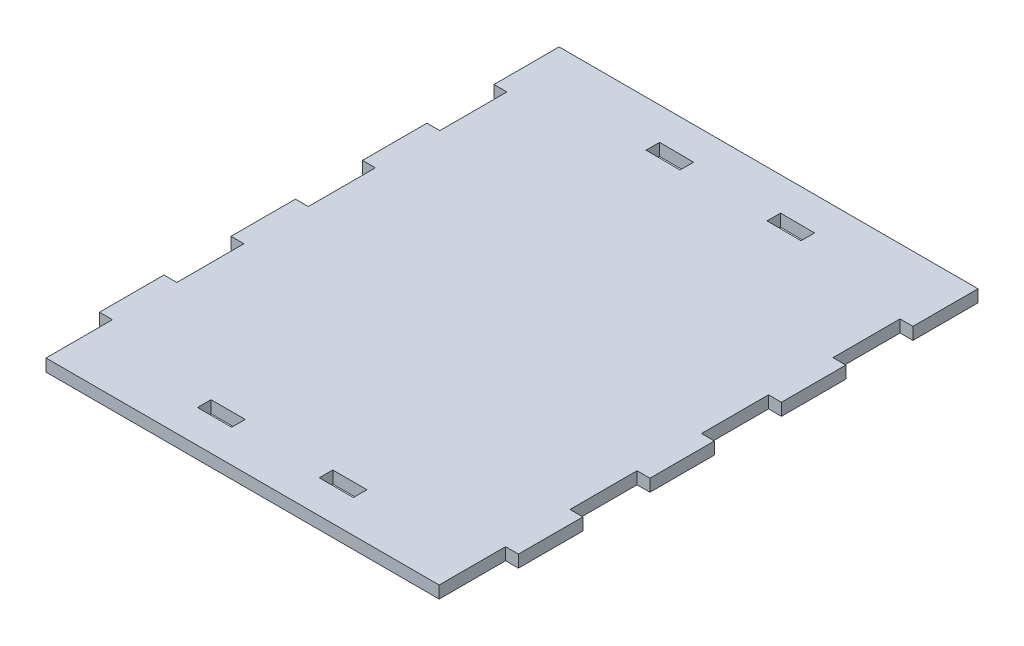
from build123d import *

# Parameters (mm, degrees)
BOSS_EXTRUDE1_DEPTH = 2.3622
CUT_EXTRUDE1_DEPTH  = 129.530658543
SKETCH3_W           = 6.604
SKETCH3_H           = 2.6162
CUT_EXTRUDE2_DEPTH  = 129.452945695
CUT_EXTRUDE3_DEPTH  = 0.127


with BuildPart() as part:
    # Sketch1 → Boss-Extrude1 (new body)
    with BuildSketch(Plane(origin=(0, 0, 0), x_dir=(1, 0, 0), z_dir=(0, 1, 0))):
        Polygon((0, 0), (76.2, 0), (76.2, 12.7), (78.6892, 12.7), (78.6892, 25.4), (76.2, 25.4), (76.2, 38.1), (78.6892, 38.1), (78.6892, 50.8), (76.2, 50.8), (76.2, 63.5), (78.6892, 63.5), (78.6892, 76.2), (76.2, 76.2), (76.2, 88.9), (78.6892, 88.9), (78.6892, 101.6), (-2.4892, 101.6), (-2.4892, 88.9), (0, 88.9), (0, 76.2), (-2.4892, 76.2), (-2.4892, 63.5), (0, 63.5), (0, 50.8), (-2.4892, 50.8), (-2.4892, 38.1), (0, 38.1), (0, 25.4), (-2.4892, 25.4), (-2.4892, 12.7), (0, 12.7), align=None)
    extrude(amount=BOSS_EXTRUDE1_DEPTH)

    # Sketch2 → Cut-Extrude1 (cut, through all)
    with BuildSketch(Plane(origin=(0, 2.3622, 0), x_dir=(1, 0, 0), z_dir=(0, 1, 0))):
        Polygon((-2.3622, 101.6), (-2.4892, 101.6), (-2.4892, 88.9), (0, 88.9), (0, 76.2), (-2.4892, 76.2), (-2.4892, 63.5), (0, 63.5), (0, 50.8), (-2.4892, 50.8), (-2.4892, 38.1), (0, 38.1), (0, 25.4), (-2.4892, 25.4), (-2.4892, 12.7), (0, 12.7), (0, 0), (0.127, 0), (0.127, 12.827), (-2.3622, 12.827), (-2.3622, 25.273), (0.127, 25.273), (0.127, 38.227), (-2.3622, 38.227), (-2.3622, 50.673), (0.127, 50.673), (0.127, 63.627), (-2.3622, 63.627), (-2.3622, 76.073), (0.127, 76.073), (0.127, 89.027), (-2.3622, 89.027), align=None)
        Polygon((78.6892, 101.6), (78.5622, 101.6), (78.5622, 89.027), (76.073, 89.027), (76.073, 76.073), (78.5622, 76.073), (78.5622, 63.627), (76.073, 63.627), (76.073, 50.673), (78.5622, 50.673), (78.5622, 38.227), (76.073, 38.227), (76.073, 25.273), (78.5622, 25.273), (78.5622, 12.827), (76.073, 12.827), (76.073, 0), (76.2, 0), (76.2, 12.7), (78.6892, 12.7), (78.6892, 25.4), (76.2, 25.4), (76.2, 38.1), (78.6892, 38.1), (78.6892, 50.8), (76.2, 50.8), (76.2, 63.5), (78.6892, 63.5), (78.6892, 76.2), (76.2, 76.2), (76.2, 88.9), (78.6892, 88.9), align=None)
    extrude(amount=-CUT_EXTRUDE1_DEPTH, mode=Mode.SUBTRACT)

    # Sketch3 → Cut-Extrude2 (cut, through all)
    with BuildSketch(Plane.XZ):
        with Locations((26.3398, -7.6581)):
            Rectangle(SKETCH3_W, SKETCH3_H)
        with Locations((49.8602, -7.6581)):
            Rectangle(SKETCH3_W, SKETCH3_H)
        Polygon((23.300704354, -92.727527231), (29.904574235, -92.686071267), (29.920997174, -95.30221972), (23.317127293, -95.343675683), align=None)
        Polygon((46.837063869, -95.196028676), (46.82064093, -92.579880223), (53.424510811, -92.53842426), (53.44093375, -95.154572713), align=None)
    extrude(amount=-CUT_EXTRUDE2_DEPTH, mode=Mode.SUBTRACT)

    # Sketch5 → Cut-Extrude3 (cut)
    with BuildSketch(Plane.XZ):
        with BuildLine():
            add(Edge.make_bspline(
                [(44.593320074, -13.403613505), (44.587890519, -13.483182338), (44.577265321, -13.638892071), (44.543097678, -13.86646136), (44.491756487, -14.08207723), (44.424489943, -14.286013878), (44.341144557, -14.478419988), (44.240097895, -14.658679135), (44.123913829, -14.828603544), (43.990292378, -14.98481976), (43.843269575, -15.12696895), (43.68106605, -15.250160973), (43.506665654, -15.356112906), (43.318232975, -15.443151948), (43.116461204, -15.511764706), (42.901304716, -15.561491076), (42.673256187, -15.593816386), (42.516659468, -15.599873576), (42.436628466, -15.60296919)],
                knots=[0, 0, 0, 0, 1.110623255, 2.173399347, 3.201158281, 4.194452171, 5.161061989, 6.11715073, 7.068774745, 8.023715476, 8.975814015, 9.911919523, 10.854875743, 11.812936516, 12.797274061, 13.818198305, 14.884958903, 16, 16, 16, 16], degree=3))
            add(Edge.make_bspline(
                [(42.436628466, -15.60296919), (42.356984127, -15.599109986), (42.201894279, -15.591595036), (41.977589159, -15.556673733), (41.768239382, -15.505574987), (41.573820047, -15.437516198), (41.394928576, -15.350443489), (41.232451636, -15.244071619), (41.083885204, -15.12122771), (40.952646335, -14.97903509), (40.832385503, -14.824607319), (40.716002146, -14.663708137), (40.606344913, -14.494774973), (40.50138181, -14.318745458), (40.403164999, -14.134788903), (40.309854267, -13.943539067), (40.222657112, -13.744725725), (40.169744433, -13.608364081), (40.142925117, -13.539247829)],
                knots=[0, 0, 0, 0, 1.152564704, 2.2443665, 3.277085452, 4.26568613, 5.217835182, 6.146948387, 7.0681669, 7.998570684, 8.938958005, 9.898076736, 10.869715129, 11.850793525, 12.861349934, 13.884731394, 14.92785512, 16, 16, 16, 16], degree=3))
            add(Edge.make_bspline(
                [(40.142925117, -13.539247829), (40.120758152, -13.480661678), (40.075918235, -13.362152075), (39.99546329, -13.187515701), (39.905768496, -13.011976417), (39.824300712, -12.866966668), (39.753044594, -12.755214868), (39.691380954, -12.682390145), (39.623310377, -12.620602356), (39.549906428, -12.568864073), (39.470321181, -12.528085862), (39.385379093, -12.497230035), (39.294005917, -12.477253493), (39.230844832, -12.473314684), (39.198530991, -12.47129955)],
                knots=[0, 0, 0, 0, 1.481680069, 2.997181249, 4.546215813, 6.144988665, 6.931698656, 7.677843942, 8.394981784, 9.10159358, 9.796315303, 10.504374672, 11.234823151, 12, 12, 12, 12], degree=3))
            add(Edge.make_bspline(
                [(39.198530991, -12.47129955), (39.14390637, -12.477415645), (39.039446578, -12.48911158), (38.893786549, -12.538653498), (38.769109823, -12.615512315), (38.66944776, -12.721006544), (38.587579551, -12.843043526), (38.516399099, -12.977943467), (38.454928906, -13.124430609), (38.424033428, -13.228198189), (38.40827373, -13.281129746)],
                knots=[0, 0, 0, 0, 1.077128553, 2.059815217, 2.995322191, 3.924120469, 4.885994435, 5.874829762, 6.915956528, 8, 8, 8, 8], degree=3))
            Line((38.40827373, -13.281129746), (37.948309752, -13.281414069))
            add(Edge.make_bspline(
                [(37.948309752, -13.281414069), (37.952480201, -13.200086921), (37.960677084, -13.040241039), (37.992102066, -12.805876842), (38.043101297, -12.582439071), (38.108580855, -12.367871786), (38.193586095, -12.164053673), (38.293424625, -11.969000115), (38.414028834, -11.786636327), (38.546779473, -11.612878641), (38.697195983, -11.454803281), (38.862678184, -11.316222812), (39.041707859, -11.197890497), (39.233767222, -11.098916419), (39.44030354, -11.022630771), (39.659720403, -10.964518161), (39.892636536, -10.927886689), (40.052682, -10.919520779), (40.134361957, -10.915251198)],
                knots=[0, 0, 0, 0, 1.087614381, 2.137670914, 3.153950445, 4.146401439, 5.130716097, 6.100421409, 7.06893252, 8.047411419, 9.018370588, 9.977398338, 10.924704657, 11.8797325, 12.857134188, 13.860010482, 14.907846257, 16, 16, 16, 16], degree=3))
            add(Edge.make_bspline(
                [(40.134361957, -10.915251198), (40.184129768, -10.914395575), (40.283832296, -10.91268146), (40.432802526, -10.92554389), (40.581002918, -10.949946725), (40.728032882, -10.987897172), (40.873485584, -11.040154357), (41.019031763, -11.102533507), (41.163065958, -11.178480964), (41.306231638, -11.268091992), (41.447232888, -11.375495151), (41.584691657, -11.504487873), (41.7163627, -11.657619929), (41.844843255, -11.832008492), (41.969377561, -12.028477278), (42.090470797, -12.2470814), (42.207809671, -12.488125469), (42.279635043, -12.658512191), (42.316744238, -12.746543952)],
                knots=[0, 0, 0, 0, 0.780832388, 1.564283445, 2.342909345, 3.136155057, 3.943832044, 4.76658362, 5.619717641, 6.49692767, 7.414757874, 8.397339337, 9.449788997, 10.580101974, 11.794534428, 13.098131979, 14.500725005, 16, 16, 16, 16], degree=3))
            add(Edge.make_bspline(
                [(42.316744238, -12.746543952), (42.343168181, -12.808556622), (42.394065937, -12.928005324), (42.468638711, -13.0994585), (42.544211639, -13.253838051), (42.615226054, -13.393192901), (42.685793014, -13.515962992), (42.751631612, -13.624229523), (42.818591004, -13.714622801), (42.881184393, -13.792433682), (42.944448165, -13.856968129), (43.008688331, -13.911495744), (43.074668972, -13.957417507), (43.143673092, -13.992707362), (43.213736182, -14.020061494), (43.285562842, -14.038485443), (43.359104621, -14.049057913), (43.40872095, -14.047635026), (43.433624855, -14.046920837)],
                knots=[0, 0, 0, 0, 1.775715228, 3.420379677, 4.924062522, 6.302860124, 7.539243049, 8.653920299, 9.637918232, 10.500247069, 11.282602574, 12.014281318, 12.717413316, 13.394804038, 14.051085964, 14.69458541, 15.344773757, 16, 16, 16, 16], degree=3))
            add(Edge.make_bspline(
                [(43.433624855, -14.046920837), (43.475907884, -14.043730301), (43.558424759, -14.037503854), (43.675956213, -13.999435656), (43.781842674, -13.939221163), (43.875904088, -13.859121968), (43.956662005, -13.762847189), (44.028699484, -13.657208659), (44.087590856, -13.54011235), (44.117118191, -13.456825135), (44.132133982, -13.414470367)],
                knots=[0, 0, 0, 0, 1.006909149, 1.965019972, 2.912890735, 3.891352914, 4.88979891, 5.897035745, 6.930561378, 8, 8, 8, 8], degree=3))
            Line((44.132133982, -13.414470367), (44.593320074, -13.403613505))
        make_face()
        with BuildLine():
            add(Edge.make_bspline(
                [(44.162023804, -11.154614672), (44.174488042, -11.15357424), (44.202066982, -11.151272132), (44.248184207, -11.156261959), (44.302842735, -11.165111604), (44.36363314, -11.176393004), (44.42603917, -11.199539226), (44.472896779, -11.250469395), (44.504513918, -11.31871874), (44.5105305, -11.371140432), (44.513806219, -11.399681345)],
                knots=[0, 0, 0, 0, 0.610088966, 1.349910546, 2.2575362, 3.316818249, 4.379282738, 5.43631259, 6.604204183, 8, 8, 8, 8], degree=3))
            add(Edge.make_bspline(
                [(44.513806219, -11.399681345), (44.509839536, -11.423351662), (44.502260906, -11.468575488), (44.469390418, -11.528630831), (44.423609452, -11.578367951), (44.362946039, -11.609867348), (44.303489711, -11.643287856), (44.257148974, -11.692651034), (44.224676418, -11.75300989), (44.216130423, -11.798085689), (44.211649031, -11.821722761)],
                knots=[0, 0, 0, 0, 1.053802676, 2.013365006, 2.982361463, 3.993204195, 5.013484542, 5.982480999, 6.94204333, 8, 8, 8, 8], degree=3))
            add(Edge.make_bspline(
                [(44.211649031, -11.821722761), (44.223339257, -11.841147586), (44.252622774, -11.889805943), (44.29625802, -11.982759796), (44.353445834, -12.107231873), (44.422354751, -12.258461748), (44.489157474, -12.43090586), (44.539996405, -12.61783328), (44.576318581, -12.813032553), (44.586783501, -12.946612072), (44.59209796, -13.014448503)],
                knots=[0, 0, 0, 0, 0.430442205, 1.078239328, 1.948171514, 3.033520824, 4.234771768, 5.456280654, 6.70820883, 8, 8, 8, 8], degree=3))
            Line((44.59209796, -13.014448503), (44.133354901, -13.014855874))
            add(Edge.make_bspline(
                [(44.133354901, -13.014855874), (44.121658915, -12.973372701), (44.098512087, -12.891275831), (44.054577511, -12.771645025), (43.999991852, -12.658216991), (43.939204992, -12.548232834), (43.867662397, -12.444375388), (43.787989621, -12.34496944), (43.699581873, -12.250565329), (43.571816813, -12.132861586), (43.400567166, -12.003437552), (43.180169972, -11.88015646), (42.950006337, -11.786086172), (42.788832934, -11.753577531), (42.708202943, -11.737314478)],
                knots=[0, 0, 0, 0, 0.767068849, 1.518060138, 2.264830364, 3.00579292, 3.752704233, 4.506531376, 5.271700119, 6.052443377, 7.597035993, 9.078961103, 10.538695976, 12, 12, 12, 12], degree=3))
            add(Edge.make_bspline(
                [(42.708202943, -11.737314478), (42.666401109, -11.729627331), (42.584971819, -11.714652894), (42.493119254, -11.66666388), (42.4329035, -11.614137072), (42.400759584, -11.562287685), (42.381062304, -11.500501643), (42.377395439, -11.456106438), (42.375463043, -11.432710673)],
                knots=[0, 0, 0, 0, 1.529757902, 2.979943463, 3.678768557, 4.394176166, 5.153749205, 6, 6, 6, 6], degree=3))
            add(Edge.make_bspline(
                [(42.375463043, -11.432710673), (42.377679444, -11.405084653), (42.381764943, -11.35416153), (42.408555788, -11.286397533), (42.448611071, -11.232030111), (42.527176379, -11.187741804), (42.641102771, -11.157610133), (42.736138643, -11.155096087), (42.785271375, -11.153796346)],
                knots=[0, 0, 0, 0, 0.877474947, 1.617452092, 2.292539893, 2.980482955, 4.438935555, 6, 6, 6, 6], degree=3))
            Line((42.785271375, -11.153796346), (44.162023804, -11.154614672))
        make_face()
        with BuildLine():
            add(Edge.make_bspline(
                [(38.384797915, -15.595630534), (38.374255707, -15.596440323), (38.349283021, -15.598358576), (38.306105553, -15.589860203), (38.251338161, -15.579337777), (38.187803821, -15.564158036), (38.122976806, -15.536730467), (38.072197923, -15.484187624), (38.036958395, -15.414475477), (38.029420776, -15.360397777), (38.025378184, -15.331394713)],
                knots=[0, 0, 0, 0, 0.504324444, 1.194658261, 2.090710493, 3.179951384, 4.32415756, 5.401078316, 6.606140973, 8, 8, 8, 8], degree=3))
            add(Edge.make_bspline(
                [(38.025378184, -15.331394713), (38.029598934, -15.309037898), (38.037829963, -15.265439106), (38.068062382, -15.206975231), (38.111343825, -15.157809894), (38.167834378, -15.123516586), (38.225311593, -15.08603441), (38.268000404, -15.027274577), (38.295922697, -14.954270249), (38.303776677, -14.900230885), (38.307962437, -14.871430735)],
                knots=[0, 0, 0, 0, 0.966497575, 1.884800112, 2.772078409, 3.72294171, 4.693971355, 5.675391614, 6.761105485, 8, 8, 8, 8], degree=3))
            add(Edge.make_bspline(
                [(38.307962437, -14.871430735), (38.298363494, -14.836171835), (38.278553269, -14.763404783), (38.236009566, -14.654270687), (38.18267165, -14.541661574), (38.126280323, -14.447773726), (38.081896611, -14.364936458), (38.053077442, -14.291651523), (38.025931377, -14.209713866), (38.003221342, -14.11803043), (37.983615908, -14.017188861), (37.968003947, -13.907337145), (37.955992413, -13.788133107), (37.950130156, -13.705635267), (37.947086443, -13.662801983)],
                knots=[0, 0, 0, 0, 1.031203918, 2.128190875, 3.302404095, 4.544914524, 5.219546929, 5.952933241, 6.764902385, 7.655740217, 8.617702419, 9.664726793, 10.787514683, 12, 12, 12, 12], degree=3))
            Line((37.947086443, -13.662801983), (38.40827373, -13.662801983))
            add(Edge.make_bspline(
                [(38.40827373, -13.662801983), (38.421293882, -13.708752717), (38.447141738, -13.799974997), (38.500621141, -13.931192836), (38.563646591, -14.056108673), (38.6392503, -14.173626443), (38.726629981, -14.283728874), (38.824554669, -14.387988707), (38.933907531, -14.48500339), (39.09350324, -14.602369745), (39.303082364, -14.73092486), (39.563305682, -14.856286604), (39.828257109, -14.952483121), (40.009815694, -14.989038212), (40.100109321, -15.007217973)],
                knots=[0, 0, 0, 0, 0.7529333, 1.494737667, 2.231223569, 2.957468608, 3.694880996, 4.445750519, 5.211274001, 5.997359444, 7.568424484, 9.081801688, 10.548706959, 12, 12, 12, 12], degree=3))
            add(Edge.make_bspline(
                [(40.100109321, -15.007217973), (40.136619818, -15.017183139), (40.209709725, -15.037132281), (40.285789375, -15.096357901), (40.335671367, -15.153559387), (40.360816292, -15.205325847), (40.379309394, -15.261676792), (40.382337752, -15.301871913), (40.383916882, -15.322831554)],
                knots=[0, 0, 0, 0, 1.46994983, 2.942674134, 3.691192763, 4.426991665, 5.17975893, 6, 6, 6, 6], degree=3))
            add(Edge.make_bspline(
                [(40.383916882, -15.322831554), (40.381323431, -15.349664399), (40.376487712, -15.399696633), (40.347255164, -15.466766005), (40.301620658, -15.518622612), (40.219192125, -15.560616759), (40.105223539, -15.591427818), (40.01061372, -15.594224692), (39.963098774, -15.595629339)],
                knots=[0, 0, 0, 0, 0.852179291, 1.588964286, 2.286292438, 2.999924125, 4.493301812, 6, 6, 6, 6], degree=3))
            Line((39.963098774, -15.595629339), (38.384797915, -15.595630534))
        make_face()
        with BuildLine():
            add(Edge.make_bspline(
                [(39.057944895, -19.752432657), (39.022844019, -19.75085745), (38.95872662, -19.74798008), (38.871033922, -19.754440899), (38.800915458, -19.765254359), (38.743336991, -19.784646768), (38.697512173, -19.82371792), (38.660481208, -19.883299898), (38.625235192, -19.963627089), (38.607621084, -20.026150985), (38.59788654, -20.060705192)],
                knots=[0, 0, 0, 0, 1.32790311, 2.425628721, 3.318150409, 4.011315829, 4.690616539, 5.546126267, 6.643851878, 8, 8, 8, 8], degree=3))
            add(Edge.make_bspline(
                [(38.59788654, -20.060705192), (38.588771235, -20.089026524), (38.571690057, -20.14209789), (38.517850927, -20.203917526), (38.449041944, -20.2459249), (38.39586302, -20.251209555), (38.367904551, -20.253987928)],
                knots=[0, 0, 0, 0, 1.091054396, 2.04452768, 2.971923301, 4, 4, 4, 4], degree=3))
            add(Edge.make_bspline(
                [(38.367904551, -20.253987928), (38.340645943, -20.250052944), (38.289641112, -20.242690014), (38.222035755, -20.211706207), (38.170639095, -20.164388284), (38.142958646, -20.103610187), (38.12527219, -20.045144371), (38.112001773, -19.995402289), (38.102417501, -19.956657892), (38.103298599, -19.934328404), (38.103669925, -19.924917954)],
                knots=[0, 0, 0, 0, 1.400838523, 2.621173137, 3.740682438, 4.886230319, 5.979477563, 6.863485528, 7.521031866, 8, 8, 8, 8], degree=3))
            Line((38.103669925, -19.924917954), (38.104892039, -17.554128253))
            add(Edge.make_bspline(
                [(38.104892039, -17.554128253), (38.103993878, -17.544315796), (38.101914366, -17.521597006), (38.112167523, -17.482433478), (38.125209353, -17.432698361), (38.142977945, -17.374230043), (38.170633974, -17.31345269), (38.222037238, -17.266134566), (38.289640661, -17.235150818), (38.340645786, -17.227787879), (38.367904551, -17.22385289)],
                knots=[0, 0, 0, 0, 0.498614946, 1.154443609, 2.036142324, 3.126533734, 4.269089158, 5.385674021, 6.602820817, 8, 8, 8, 8], degree=3))
            add(Edge.make_bspline(
                [(38.367904551, -17.22385289), (38.395759512, -17.227269246), (38.448470473, -17.23373414), (38.518676255, -17.273659429), (38.570942106, -17.33674241), (38.58858241, -17.389375201), (38.59788654, -17.417135625)],
                knots=[0, 0, 0, 0, 1.032711641, 1.954237968, 2.920991641, 4, 4, 4, 4], degree=3))
            add(Edge.make_bspline(
                [(38.59788654, -17.417135625), (38.607584687, -17.451713651), (38.625132938, -17.514280643), (38.660910464, -17.594660927), (38.697115191, -17.655202501), (38.743368524, -17.694413083), (38.800907785, -17.713744196), (38.870991709, -17.725013855), (38.958741161, -17.729065173), (39.022790329, -17.72749317), (39.057850519, -17.726632664)],
                knots=[0, 0, 0, 0, 1.354387758, 2.450688454, 3.317903348, 3.996322285, 4.688587933, 5.579951073, 6.675277519, 8, 8, 8, 8], degree=3))
            Line((39.057850519, -17.726632664), (44.436736592, -17.726633859))
            Line((44.436736592, -17.726633859), (44.436736592, -19.752432657))
            Line((44.436736592, -19.752432657), (39.057944895, -19.752432657))
        make_face()
        with BuildLine():
            Line((44.436736592, -16.089847149), (44.436736592, -17.31805003))
            Line((44.436736592, -17.31805003), (43.976771419, -17.31805003))
            add(Edge.make_bspline(
                [(43.976771419, -17.31805003), (43.934139503, -17.266558364), (43.850516757, -17.165557168), (43.701999905, -17.038259281), (43.539988094, -16.934096913), (43.363527179, -16.85823217), (43.183720488, -16.796772262), (43.003635521, -16.747267271), (42.825945536, -16.705504301), (42.707123294, -16.687283558), (42.648260828, -16.67825732)],
                knots=[0, 0, 0, 0, 1.057704978, 2.074694327, 3.08571284, 4.098072705, 5.109607333, 6.095746358, 7.056665962, 8, 8, 8, 8], degree=3))
            add(Edge.make_bspline(
                [(42.648260828, -16.67825732), (42.600655829, -16.671202951), (42.506542656, -16.657256748), (42.394977199, -16.618278066), (42.316759141, -16.569873507), (42.273856405, -16.516209542), (42.247888011, -16.447869816), (42.242540335, -16.397947979), (42.239675805, -16.371206898)],
                knots=[0, 0, 0, 0, 1.524550261, 3.013974697, 3.713404531, 4.412236306, 5.149500086, 6, 6, 6, 6], degree=3))
            add(Edge.make_bspline(
                [(42.239675805, -16.371206898), (42.242078716, -16.342812871), (42.246491038, -16.290674616), (42.270452023, -16.221791001), (42.302777942, -16.166753393), (42.348652307, -16.133175498), (42.393166456, -16.112733142), (42.430638158, -16.097932134), (42.461068806, -16.088551497), (42.478996394, -16.089453936), (42.486784113, -16.089845954)],
                knots=[0, 0, 0, 0, 1.630390866, 2.993789385, 4.163667133, 5.232256894, 6.196325233, 6.975187169, 7.554822771, 8, 8, 8, 8], degree=3))
            Line((42.486784113, -16.089845954), (44.436736592, -16.089847149))
        make_face()
        with BuildLine():
            add(Edge.make_bspline(
                [(42.487233296, -21.389219367), (42.479272017, -21.389705147), (42.461033977, -21.390817993), (42.430891958, -21.379375375), (42.393115688, -21.365319117), (42.348631013, -21.344618583), (42.303227192, -21.311212845), (42.269781552, -21.256807731), (42.246799658, -21.187436348), (42.242175546, -21.134987275), (42.239675805, -21.10663392)],
                knots=[0, 0, 0, 0, 0.45280392, 1.037302727, 1.814488353, 2.776481768, 3.842771649, 4.990534441, 6.373118154, 8, 8, 8, 8], degree=3))
            add(Edge.make_bspline(
                [(42.239675805, -21.10663392), (42.242540335, -21.079892839), (42.247888011, -21.029971002), (42.273856405, -20.961631276), (42.316759141, -20.90796731), (42.394977199, -20.859562751), (42.506542656, -20.82058407), (42.600655829, -20.806637867), (42.648260828, -20.799583498)],
                knots=[0, 0, 0, 0, 0.850499914, 1.587763694, 2.286595469, 2.986025303, 4.475449739, 6, 6, 6, 6], degree=3))
            add(Edge.make_bspline(
                [(42.648260828, -20.799583498), (42.707123298, -20.790557263), (42.825945548, -20.772336528), (43.003635471, -20.730573502), (43.183720684, -20.681068734), (43.363526428, -20.619607963), (43.539990898, -20.54374646), (43.701989433, -20.439571994), (43.850117659, -20.312696212), (43.93331535, -20.212089363), (43.9755505, -20.161016486)],
                knots=[0, 0, 0, 0, 0.944410683, 1.906427004, 2.893691528, 3.906380641, 4.919895932, 5.93206834, 6.950218399, 8, 8, 8, 8], degree=3))
            Line((43.9755505, -20.161016486), (44.436736592, -20.161016486))
            Line((44.436736592, -20.161016486), (44.436736592, -21.389219367))
            Line((44.436736592, -21.389219367), (42.487233296, -21.389219367))
        make_face()
        with BuildLine():
            add(Edge.make_bspline(
                [(44.593320074, -24.804639225), (44.578203943, -24.912677883), (44.548689859, -25.123622216), (44.471762207, -25.426540078), (44.373099319, -25.708245059), (44.25050518, -25.968959726), (44.101892561, -26.207544139), (43.92825329, -26.423988718), (43.73124589, -26.619150705), (43.509976204, -26.789622123), (43.271469578, -26.938602544), (43.021312855, -27.070771665), (42.758175968, -27.18060872), (42.483511465, -27.271604101), (42.196650172, -27.341151715), (41.898072049, -27.389509744), (41.588273651, -27.419624067), (41.377720616, -27.423204281), (41.27081551, -27.42502208)],
                knots=[0, 0, 0, 0, 1.114652587, 2.176347341, 3.189017478, 4.162473963, 5.11568698, 6.055864808, 6.993330424, 7.944014693, 8.905190016, 9.865560315, 10.833421122, 11.816922617, 12.821000386, 13.847707233, 14.907206031, 16, 16, 16, 16], degree=3))
            add(Edge.make_bspline(
                [(41.27081551, -27.42502208), (41.163501586, -27.423218242), (40.952538611, -27.419672168), (40.64234192, -27.389480818), (40.344126322, -27.341317889), (40.057745522, -27.271435229), (39.783163549, -27.180343172), (39.51936742, -27.071089489), (39.268953794, -26.938564853), (39.03042896, -26.789631318), (38.809156626, -26.619151186), (38.612177373, -26.423977945), (38.438427629, -26.207587194), (38.290144795, -25.9686451), (38.16586488, -25.708565347), (38.067176697, -25.426678989), (37.991960683, -25.123066977), (37.962307114, -24.911873879), (37.947086443, -24.803472065)],
                knots=[0, 0, 0, 0, 1.096366563, 2.155291165, 3.181441588, 4.180927294, 5.16389578, 6.135074312, 7.094924138, 8.055578552, 9.005747598, 9.942705154, 10.882373453, 11.835069876, 12.809790572, 13.821911891, 14.882024524, 16, 16, 16, 16], degree=3))
            Line((37.947086443, -24.803472065), (38.443724588, -24.804639225))
            add(Edge.make_bspline(
                [(38.443724588, -24.804639225), (38.461895819, -24.84940118), (38.495755759, -24.932809793), (38.563946056, -25.039662875), (38.63806738, -25.122412126), (38.721998366, -25.175709853), (38.806830126, -25.210084187), (38.89100536, -25.231148355), (38.974607551, -25.245463493), (39.030067747, -25.243582222), (39.057850519, -25.242639799)],
                knots=[0, 0, 0, 0, 1.414265454, 2.635316518, 3.701552682, 4.643767698, 5.523392507, 6.376344536, 7.186630204, 8, 8, 8, 8], degree=3))
            Line((39.057850519, -25.242639799), (43.483301452, -25.242639799))
            add(Edge.make_bspline(
                [(43.483301452, -25.242639799), (43.510829544, -25.243534134), (43.566432992, -25.245340583), (43.64988134, -25.231477482), (43.733916526, -25.209822472), (43.818419094, -25.175743719), (43.902330709, -25.122398489), (43.976494602, -25.039680849), (44.0447828, -24.932302297), (44.0792777, -24.848609118), (44.097881345, -24.803472065)],
                knots=[0, 0, 0, 0, 0.805268527, 1.626545965, 2.467069336, 3.345794957, 4.287046803, 5.352193018, 6.571995874, 8, 8, 8, 8], degree=3))
            Line((44.097881345, -24.803472065), (44.593320074, -24.804639225))
        make_face()
        with BuildLine():
            add(Edge.make_bspline(
                [(37.948308557, -24.41816813), (37.962958704, -24.309721419), (37.991454132, -24.098785957), (38.067726953, -23.795492043), (38.165512899, -23.513313852), (38.290268037, -23.253038781), (38.437954159, -23.014033071), (38.61302698, -22.798800356), (38.808651165, -22.602357903), (39.030506799, -22.432050251), (39.268924583, -22.282991315), (39.519406342, -22.150616178), (39.782917513, -22.040932286), (40.057985704, -21.951664852), (40.344223995, -21.881779724), (40.642213181, -21.831792033), (40.95253496, -21.801724947), (41.163504142, -21.799125452), (41.27081551, -21.797803196)],
                knots=[0, 0, 0, 0, 1.117577422, 2.173756167, 3.189913376, 4.164736403, 5.117532845, 6.054051182, 6.994039849, 7.944308649, 8.905063916, 9.865014512, 10.836295004, 11.818067478, 12.817658115, 13.844601351, 14.903637124, 16, 16, 16, 16], degree=3))
            add(Edge.make_bspline(
                [(41.27081551, -21.797803196), (41.377718103, -21.799139382), (41.588277503, -21.801771184), (41.898200735, -21.831763741), (42.196552249, -21.881947441), (42.483270613, -21.951497999), (42.758421282, -22.040668797), (43.021274018, -22.150933789), (43.271498792, -22.282953628), (43.50989836, -22.432059445), (43.731751363, -22.602358374), (43.927403668, -22.798789577), (44.10236661, -23.014075884), (44.250381351, -23.252724199), (44.373451989, -23.513634498), (44.471200121, -23.795633944), (44.549323333, -24.098585389), (44.577578767, -24.309665406), (44.59209796, -24.418129902)],
                knots=[0, 0, 0, 0, 1.092529736, 2.151887993, 3.179143942, 4.183088523, 5.165159955, 6.132892376, 7.093135285, 8.05418311, 9.004741274, 9.945016175, 10.88181969, 11.834906266, 12.808233624, 13.824700261, 14.882211623, 16, 16, 16, 16], degree=3))
            Line((44.59209796, -24.418129902), (44.098300663, -24.41816813))
            add(Edge.make_bspline(
                [(44.098300663, -24.41816813), (44.079525422, -24.373038172), (44.044735052, -24.289412722), (43.976533118, -24.181853162), (43.902260178, -24.099391109), (43.81876213, -24.045351061), (43.733386057, -24.013848127), (43.650249916, -23.989217769), (43.566038472, -23.97797717), (43.510303631, -23.979451508), (43.482557193, -23.980185476)],
                knots=[0, 0, 0, 0, 1.428903656, 2.647746985, 3.712055329, 4.652566763, 5.52612489, 6.369121383, 7.188100826, 8, 8, 8, 8], degree=3))
            Line((43.482557193, -23.980185476), (39.058723798, -23.980187865))
            add(Edge.make_bspline(
                [(39.058723798, -23.980187865), (39.030680275, -23.979406575), (38.975047094, -23.977856641), (38.890639528, -23.989545928), (38.807359814, -24.01359246), (38.721655602, -24.045386288), (38.638140937, -24.099378443), (38.563892365, -24.181864347), (38.495631484, -24.289317656), (38.461132314, -24.37299915), (38.442526367, -24.418129902)],
                knots=[0, 0, 0, 0, 0.819790178, 1.626312552, 2.480155717, 3.353040538, 4.29282706, 5.356315075, 6.574218964, 8, 8, 8, 8], degree=3))
            Line((38.442526367, -24.418129902), (37.948308557, -24.41816813))
        make_face()
        with BuildLine():
            Line((44.436736592, -31.114520374), (44.436736592, -33.343255771))
            add(Edge.make_bspline(
                [(44.436736592, -33.343255771), (44.435566593, -33.365459885), (44.432714788, -33.419581115), (44.408280631, -33.488388809), (44.373003504, -33.548460247), (44.324519654, -33.583317688), (44.262128782, -33.604768319), (44.215910349, -33.610585648), (44.190852788, -33.613739543)],
                knots=[0, 0, 0, 0, 0.967554368, 2.358357197, 3.143637774, 3.969841345, 4.899339017, 6, 6, 6, 6], degree=3))
            add(Edge.make_bspline(
                [(44.190852788, -33.613739543), (44.165086185, -33.61012139), (44.11580914, -33.603201895), (44.049923051, -33.565153871), (44.001831438, -33.504025153), (43.98465429, -33.454202421), (43.9755505, -33.427796659)],
                knots=[0, 0, 0, 0, 1.014611198, 1.940381636, 2.908414067, 4, 4, 4, 4], degree=3))
            add(Edge.make_bspline(
                [(43.9755505, -33.427796659), (43.965591933, -33.395774502), (43.947503735, -33.337611199), (43.914137372, -33.261176789), (43.875862649, -33.205511453), (43.829526438, -33.16825862), (43.771192176, -33.152784674), (43.701189235, -33.14208821), (43.613460976, -33.137834845), (43.549419301, -33.139440335), (43.514363213, -33.140319172)],
                knots=[0, 0, 0, 0, 1.298388268, 2.358321801, 3.217487816, 3.89340575, 4.607536757, 5.518819931, 6.641814643, 8, 8, 8, 8], degree=3))
            Line((43.514363213, -33.140319172), (39.027267807, -33.140320367))
            add(Edge.make_bspline(
                [(39.027267807, -33.140320367), (38.992211237, -33.139454388), (38.927761713, -33.137862334), (38.839630141, -33.142025434), (38.769189246, -33.152768477), (38.710954813, -33.168307819), (38.664446021, -33.205165039), (38.627952314, -33.261936525), (38.592395924, -33.337152735), (38.574617543, -33.395670441), (38.564857212, -33.427796659)],
                knots=[0, 0, 0, 0, 1.355938176, 2.492815734, 3.402591027, 4.115540377, 4.790339884, 5.638907139, 6.703760147, 8, 8, 8, 8], degree=3))
            add(Edge.make_bspline(
                [(38.564857212, -33.427796659), (38.555651473, -33.454110448), (38.538366206, -33.503518851), (38.491617863, -33.565948172), (38.424748087, -33.602855885), (38.375252082, -33.610020069), (38.349554924, -33.613739543)],
                knots=[0, 0, 0, 0, 1.090522634, 2.047632941, 2.986377121, 4, 4, 4, 4], degree=3))
            add(Edge.make_bspline(
                [(38.349554924, -33.613739543), (38.324496769, -33.610585694), (38.27827724, -33.604768449), (38.215893356, -33.583317277), (38.167387061, -33.548461576), (38.13220751, -33.488382574), (38.107087401, -33.419305111), (38.105535475, -33.364744266), (38.104893234, -33.342165067)],
                knots=[0, 0, 0, 0, 1.09803317, 2.025311678, 2.849542699, 3.632948428, 5.020430734, 6, 6, 6, 6], degree=3))
            Line((38.104893234, -33.342165067), (38.104893234, -31.114520374))
            Line((38.104893234, -31.114520374), (44.436736592, -31.114520374))
        make_face()
        with BuildLine():
            add(Edge.make_bspline(
                [(43.976771419, -30.728264314), (43.97180973, -30.697925672), (43.962250012, -30.639472013), (43.942941426, -30.555776345), (43.918394507, -30.479690116), (43.889843976, -30.410515532), (43.853272967, -30.350041366), (43.81360692, -30.295918771), (43.767534234, -30.249522489), (43.698500473, -30.20000156), (43.605432484, -30.14965993), (43.484312705, -30.109947679), (43.356487891, -30.083562893), (43.268207591, -30.083369772), (43.223215801, -30.083271348)],
                knots=[0, 0, 0, 0, 0.994519451, 1.916147118, 2.775622181, 3.579425096, 4.330619074, 5.056237467, 5.746576317, 6.435274355, 7.798826904, 9.150584682, 10.547804037, 12, 12, 12, 12], degree=3))
            Line((43.223215801, -30.083271348), (42.366899884, -30.084492267))
            add(Edge.make_bspline(
                [(42.366899884, -30.084492267), (42.326092065, -30.082419649), (42.245001925, -30.078301102), (42.124873994, -30.094346362), (42.008470098, -30.123803232), (41.915037303, -30.160655767), (41.843785519, -30.201450092), (41.797364407, -30.246005475), (41.754495662, -30.299196647), (41.720182308, -30.364997933), (41.689246988, -30.440277615), (41.66412118, -30.526456197), (41.642951103, -30.623254278), (41.634758065, -30.691973538), (41.630468195, -30.727954903)],
                knots=[0, 0, 0, 0, 1.304926134, 2.593048191, 3.858775691, 5.140406425, 5.795992843, 6.470014023, 7.185204125, 7.973420928, 8.833511362, 9.786989075, 10.841268782, 12, 12, 12, 12], degree=3))
            Line((41.630468195, -30.727954903), (41.133804963, -30.728264314))
            add(Edge.make_bspline(
                [(41.133804963, -30.728264314), (41.129856499, -30.696269412), (41.12222269, -30.634411701), (41.102573936, -30.546789089), (41.078012616, -30.467293912), (41.048491104, -30.395754205), (41.009278962, -30.334300943), (40.967249472, -30.279945191), (40.918078038, -30.234447572), (40.844671181, -30.186692332), (40.743574061, -30.141322459), (40.614043338, -30.102688234), (40.47421326, -30.083512694), (40.378256287, -30.083353357), (40.328868001, -30.083271348)],
                knots=[0, 0, 0, 0, 0.991107102, 1.916168316, 2.757145424, 3.549287424, 4.287143779, 4.992296638, 5.657975009, 6.336293971, 7.677421621, 9.050540567, 10.481936861, 12, 12, 12, 12], degree=3))
            Line((40.328868001, -30.083271348), (39.224220468, -30.084492267))
            add(Edge.make_bspline(
                [(39.224220468, -30.084492267), (39.184602528, -30.083094751), (39.107315694, -30.080368471), (38.993663032, -30.100022223), (38.886676075, -30.135963973), (38.802038272, -30.178222427), (38.739036045, -30.222706195), (38.698406332, -30.268331571), (38.66313242, -30.322587353), (38.632404568, -30.385873238), (38.606871915, -30.458046216), (38.587782014, -30.539753999), (38.573039461, -30.630504714), (38.567669071, -30.694465801), (38.564857212, -30.727954903)],
                knots=[0, 0, 0, 0, 1.343348861, 2.620610198, 3.890643401, 5.166552582, 5.82024684, 6.496580916, 7.226382861, 8.012974379, 8.880277425, 9.820783762, 10.858993827, 12, 12, 12, 12], degree=3))
            Line((38.564857212, -30.727954903), (38.104893234, -30.728264314))
            Line((38.104893234, -30.728264314), (38.104893234, -30.453593338))
            add(Edge.make_bspline(
                [(38.104893234, -30.453593338), (38.103646466, -30.306099433), (38.101208948, -30.017738638), (38.115911483, -29.660162646), (38.151289762, -29.381947728), (38.201746177, -29.176610453), (38.270197269, -28.971377758), (38.333422397, -28.839784816), (38.365457934, -28.773107995)],
                knots=[0, 0, 0, 0, 1.543415029, 3.017483233, 3.741001946, 4.473722221, 5.226650386, 6, 6, 6, 6], degree=3))
            add(Edge.make_bspline(
                [(38.365457934, -28.773107995), (38.403371283, -28.709591709), (38.477111344, -28.586054883), (38.612683855, -28.423493466), (38.761307972, -28.283601141), (38.928294693, -28.172380836), (39.109131439, -28.083966821), (39.305247423, -28.021763627), (39.516800595, -27.984455894), (39.66282373, -27.980166222), (39.738010019, -27.9779575)],
                knots=[0, 0, 0, 0, 1.059988511, 2.061638442, 3.0263773, 3.978991825, 4.928925079, 5.905953201, 6.921789976, 8, 8, 8, 8], degree=3))
            add(Edge.make_bspline(
                [(39.738010019, -27.9779575), (39.801709158, -27.980500507), (39.925537704, -27.985444008), (40.104580119, -28.011270119), (40.270450031, -28.051560013), (40.423789214, -28.105205359), (40.563720804, -28.173944793), (40.691272286, -28.256155319), (40.804931176, -28.354004159), (40.905102318, -28.466020154), (40.993317809, -28.5894346), (41.076154251, -28.718514176), (41.147985657, -28.857023012), (41.21337044, -29.001999674), (41.267787275, -29.156235008), (41.316050874, -29.317216936), (41.353503923, -29.486681234), (41.372488611, -29.602414562), (41.382136579, -29.661229932)],
                knots=[0, 0, 0, 0, 1.172616613, 2.279519186, 3.3224272, 4.309805351, 5.262939429, 6.185021551, 7.095023674, 8.014261508, 8.9433708, 9.88440459, 10.834372446, 11.811949079, 12.808919437, 13.841816865, 14.903217074, 16, 16, 16, 16], degree=3))
            Line((41.382136579, -29.661229932), (41.399262898, -29.661710176))
            add(Edge.make_bspline(
                [(41.399262898, -29.661710176), (41.407709854, -29.609263102), (41.424400035, -29.505633913), (41.458338358, -29.353173453), (41.50286328, -29.206850282), (41.554069112, -29.065250433), (41.614283697, -28.929227859), (41.682479848, -28.798170709), (41.760324736, -28.67307453), (41.844750105, -28.55310453), (41.939800947, -28.442864754), (42.045401999, -28.344990839), (42.163046931, -28.262704786), (42.290890565, -28.193505119), (42.430135937, -28.140125132), (42.579312738, -28.099792147), (42.739057874, -28.072177208), (42.849584917, -28.066504167), (42.906378912, -28.063589092)],
                knots=[0, 0, 0, 0, 1.054951561, 2.084459023, 3.099078781, 4.090584333, 5.073219329, 6.051271536, 7.022189492, 7.997522037, 8.962035251, 9.907767592, 10.849225218, 11.8058179, 12.787885391, 13.803603468, 14.871388127, 16, 16, 16, 16], degree=3))
            add(Edge.make_bspline(
                [(42.906378912, -28.063589092), (42.979970638, -28.066517594), (43.123005244, -28.072209498), (43.329537521, -28.113206952), (43.520377513, -28.180513155), (43.69411239, -28.27583024), (43.85103442, -28.395323245), (43.988500123, -28.53947015), (44.110800315, -28.704368761), (44.173460611, -28.828323998), (44.205532489, -28.891768915)],
                knots=[0, 0, 0, 0, 1.08028779, 2.099672712, 3.078921006, 4.040971804, 4.997939864, 5.963525231, 6.957656212, 8, 8, 8, 8], degree=3))
            add(Edge.make_bspline(
                [(44.205532489, -28.891768915), (44.230642415, -28.953373284), (44.280843369, -29.076535659), (44.33709808, -29.267599395), (44.381239704, -29.461541359), (44.414791357, -29.725560815), (44.43630354, -30.059233652), (44.435777839, -30.327087064), (44.435514478, -30.46127366)],
                knots=[0, 0, 0, 0, 0.748472479, 1.496381666, 2.23925875, 2.985193071, 4.489671366, 6, 6, 6, 6], degree=3))
            Line((44.435514478, -30.46127366), (44.436736592, -30.728264314))
            Line((44.436736592, -30.728264314), (43.976771419, -30.728264314))
        make_face()
        with BuildLine():
            add(Edge.make_bspline(
                [(39.442393469, -40.264868797), (39.38460483, -40.275576623), (39.27545665, -40.295801007), (39.123454891, -40.335122736), (38.991685791, -40.377566446), (38.879934489, -40.423289539), (38.788023781, -40.47289359), (38.716411392, -40.527054595), (38.663018505, -40.585762538), (38.628100287, -40.669730694), (38.5960952, -40.76451765), (38.53140398, -40.855419203), (38.447313735, -40.917102776), (38.382219129, -40.932438477), (38.349554924, -40.940133869)],
                knots=[0, 0, 0, 0, 1.557119928, 2.94100722, 4.157573147, 5.223245264, 6.137451766, 6.915583591, 7.597754131, 8.206852455, 9.306607051, 10.242526302, 11.118106966, 12, 12, 12, 12], degree=3))
            add(Edge.make_bspline(
                [(38.349554924, -40.940133869), (38.320943925, -40.935772302), (38.267656328, -40.927648942), (38.197609447, -40.889417835), (38.150170899, -40.829002011), (38.125688082, -40.755393237), (38.115067015, -40.680561435), (38.10584061, -40.612092605), (38.101434714, -40.553196728), (38.102971851, -40.517278173), (38.103669925, -40.500966134)],
                knots=[0, 0, 0, 0, 1.217615765, 2.267792861, 3.285764121, 4.387752443, 5.507540744, 6.480711038, 7.310030662, 8, 8, 8, 8], degree=3))
            Line((38.103669925, -40.500966134), (38.104892039, -39.570487142))
            add(Edge.make_bspline(
                [(38.104892039, -39.570487142), (38.103671033, -39.554025058), (38.101027521, -39.518384175), (38.106066925, -39.459723686), (38.114874052, -39.392029542), (38.125964959, -39.317731738), (38.149781404, -39.244526484), (38.198094333, -39.185244716), (38.267595948, -39.146969026), (38.320922832, -39.138875917), (38.349554924, -39.134530592)],
                knots=[0, 0, 0, 0, 0.700617789, 1.516857531, 2.494976506, 3.603381872, 4.710973929, 5.720675157, 6.776192522, 8, 8, 8, 8], degree=3))
            add(Edge.make_bspline(
                [(38.349554924, -39.134530592), (38.382156979, -39.142311257), (38.446897644, -39.157761982), (38.531787734, -39.217880041), (38.595766793, -39.308728286), (38.627878454, -39.402599465), (38.663399042, -39.485453296), (38.716370575, -39.543954848), (38.788032794, -39.598110522), (38.879953911, -39.647632203), (38.991458738, -39.693728903), (39.123726067, -39.734215053), (39.275280315, -39.774059637), (39.384308442, -39.7942341), (39.441969373, -39.804903624)],
                knots=[0, 0, 0, 0, 0.884320961, 1.756071168, 2.694567085, 3.787348452, 4.388336688, 5.072385302, 5.852659391, 6.769382783, 7.837988787, 9.054578752, 10.442276006, 12, 12, 12, 12], degree=3))
            Line((39.441969373, -39.804903624), (40.898407684, -39.804903624))
            Line((40.898407684, -39.804903624), (42.295165507, -40.249008794))
            Line((42.295165507, -40.249008794), (42.295165507, -40.264868797))
            Line((42.295165507, -40.264868797), (39.442393469, -40.264868797))
        make_face()
        with BuildLine():
            add(Edge.make_bspline(
                [(39.052994319, -36.820033388), (39.018310203, -36.818402987), (38.954601282, -36.815408213), (38.867517887, -36.822590665), (38.797142235, -36.831336552), (38.739636747, -36.851071893), (38.694273945, -36.889953019), (38.656475294, -36.948030277), (38.62340943, -37.027566396), (38.605386154, -37.088539752), (38.595439923, -37.122188187)],
                knots=[0, 0, 0, 0, 1.325212585, 2.434193911, 3.333305834, 4.033578742, 4.719844777, 5.571250455, 6.65968308, 8, 8, 8, 8], degree=3))
            add(Edge.make_bspline(
                [(38.595439923, -37.122188187), (38.586247724, -37.149666493), (38.568910053, -37.201494114), (38.515321797, -37.261945201), (38.446598599, -37.3020334), (38.394164398, -37.307639353), (38.366681243, -37.310577689)],
                knots=[0, 0, 0, 0, 1.079775479, 2.036595513, 2.970890194, 4, 4, 4, 4], degree=3))
            add(Edge.make_bspline(
                [(38.366681243, -37.310577689), (38.339432936, -37.306606527), (38.288985741, -37.299254365), (38.221959773, -37.269266481), (38.17070946, -37.223555943), (38.142909542, -37.163911257), (38.12564275, -37.106944072), (38.111465025, -37.058238096), (38.102555963, -37.020150857), (38.103349811, -36.997843041), (38.103669925, -36.988847565)],
                knots=[0, 0, 0, 0, 1.422307854, 2.633243987, 3.755463304, 4.899774119, 5.989657659, 6.846440761, 7.534835035, 8, 8, 8, 8], degree=3))
            Line((38.103669925, -36.988847565), (38.104892039, -34.633576201))
            add(Edge.make_bspline(
                [(38.104892039, -34.633576201), (38.104040308, -34.624710859), (38.101987411, -34.603343056), (38.112089569, -34.566300928), (38.125345067, -34.518681046), (38.142708789, -34.462825216), (38.171150934, -34.405025799), (38.222362551, -34.360986913), (38.28893927, -34.330849107), (38.339416638, -34.32353768), (38.366681243, -34.319588521)],
                knots=[0, 0, 0, 0, 0.465656627, 1.122354798, 1.992144895, 3.078190006, 4.201972856, 5.326780214, 6.556099808, 8, 8, 8, 8], degree=3))
            add(Edge.make_bspline(
                [(38.366681243, -34.319588521), (38.394160277, -34.323022906), (38.446517604, -34.329566629), (38.51491461, -34.369359772), (38.568617931, -34.428238395), (38.586187797, -34.478869528), (38.595439923, -34.505531406)],
                knots=[0, 0, 0, 0, 1.041578527, 1.984577334, 2.938697389, 4, 4, 4, 4], degree=3))
            add(Edge.make_bspline(
                [(38.595439923, -34.505531406), (38.60535373, -34.537585841), (38.623360628, -34.595807774), (38.657123734, -34.671668955), (38.69385471, -34.728142044), (38.740000776, -34.764768356), (38.797766655, -34.780516168), (38.867226421, -34.792933668), (38.954695018, -34.796548586), (39.018315945, -34.795048818), (39.052957285, -34.794232201)],
                knots=[0, 0, 0, 0, 1.304484423, 2.369394525, 3.223358986, 3.90245047, 4.604865159, 5.523035211, 6.651302576, 8, 8, 8, 8], degree=3))
            Line((39.052957285, -34.794232201), (43.488758555, -34.794233395))
            add(Edge.make_bspline(
                [(43.488758555, -34.794233395), (43.523369302, -34.795035333), (43.586957681, -34.796508687), (43.674021952, -34.79306708), (43.743024435, -34.780363511), (43.800409005, -34.764778785), (43.846552301, -34.728138513), (43.883284238, -34.671670263), (43.917046995, -34.595807323), (43.935053951, -34.537585681), (43.944967789, -34.505531406)],
                knots=[0, 0, 0, 0, 1.350420171, 2.481051018, 3.38548862, 4.089374719, 4.769888757, 5.625642093, 6.692782957, 8, 8, 8, 8], degree=3))
            add(Edge.make_bspline(
                [(43.944967789, -34.505531406), (43.954219915, -34.478869528), (43.971789781, -34.428238395), (44.025493102, -34.369359772), (44.093890108, -34.329566629), (44.146247435, -34.323022906), (44.173726469, -34.319588521)],
                knots=[0, 0, 0, 0, 1.061302611, 2.015422666, 2.958421473, 4, 4, 4, 4], degree=3))
            add(Edge.make_bspline(
                [(44.173726469, -34.319588521), (44.200980211, -34.323543868), (44.251437468, -34.330866751), (44.318144313, -34.360930431), (44.369070433, -34.405351013), (44.39910583, -34.462491446), (44.416440505, -34.518507918), (44.428821563, -34.566303511), (44.436466188, -34.603162127), (44.435790474, -34.624173413), (44.435514478, -34.632755485)],
                knots=[0, 0, 0, 0, 1.44642027, 2.677885429, 3.804655944, 4.940824889, 6.028765503, 6.894484036, 7.548451398, 8, 8, 8, 8], degree=3))
            Line((44.435514478, -34.632755485), (44.436736592, -36.820033388))
            Line((44.436736592, -36.820033388), (39.052994319, -36.820033388))
        make_face()
        with BuildLine():
            add(Edge.make_bspline(
                [(44.174439668, -40.975142711), (44.151505893, -40.971964322), (44.10935249, -40.966122287), (44.052496858, -40.940871646), (44.010213615, -40.899980199), (43.977781522, -40.831108769), (43.953817524, -40.74560662), (43.947750683, -40.676853822), (43.944967789, -40.645316531)],
                knots=[0, 0, 0, 0, 0.926664923, 1.703255522, 2.455999257, 3.232417184, 4.730494353, 6, 6, 6, 6], degree=3))
            add(Edge.make_bspline(
                [(43.944967789, -40.645316531), (43.943168585, -40.628879108), (43.939765543, -40.597789116), (43.924910358, -40.555122372), (43.902343791, -40.519334632), (43.859978073, -40.480971385), (43.79435577, -40.438674023), (43.738027159, -40.407618419), (43.707645949, -40.390868373)],
                knots=[0, 0, 0, 0, 0.806825665, 1.526042313, 2.190026804, 2.853111789, 4.302704975, 6, 6, 6, 6], degree=3))
            add(Edge.make_bspline(
                [(43.707645949, -40.390868373), (43.650095596, -40.36049138), (43.533675077, -40.299040751), (43.407915812, -40.260095043), (43.344323338, -40.240401433)],
                knots=[0, 0, 0, 0, 0.988663385, 2, 2, 2, 2], degree=3))
            Line((43.344323338, -40.240401433), (38.104892039, -38.515612972))
            Line((38.104892039, -38.515612972), (38.104892039, -38.272824472))
            Line((38.104892039, -38.272824472), (41.702601582, -37.221277366))
            Line((41.702601582, -37.221277366), (43.243267786, -37.221277366))
            Line((43.243267786, -37.221277366), (43.243267786, -37.237499344))
            Line((43.243267786, -37.237499344), (41.838044765, -37.602950798))
            Line((41.838044765, -37.602950798), (41.838044765, -37.619807128))
            Line((41.838044765, -37.619807128), (44.436736592, -38.515612972))
            Line((44.436736592, -38.515612972), (44.436736592, -40.620005754))
            add(Edge.make_bspline(
                [(44.436736592, -40.620005754), (44.436123556, -40.652598563), (44.434752075, -40.725515075), (44.413260631, -40.817736123), (44.377932096, -40.894404392), (44.325374662, -40.938491957), (44.255074368, -40.965529012), (44.20254366, -40.971248771), (44.173726469, -40.974386505)],
                knots=[0, 0, 0, 0, 1.159998105, 2.595143473, 3.34944068, 4.122146526, 4.969850912, 6, 6, 6, 6], degree=3))
            Line((44.173726469, -40.974386505), (44.174439668, -40.975142711))
        make_face()
        with BuildLine():
            add(Edge.make_bspline(
                [(39.034931405, -47.076250264), (39.000991732, -47.075392962), (38.938474736, -47.073813808), (38.853060616, -47.07789369), (38.784688308, -47.088810637), (38.727962491, -47.10424666), (38.68279655, -47.141298832), (38.647553718, -47.197981022), (38.613466598, -47.273388201), (38.59552907, -47.33165011), (38.585653456, -47.363726555)],
                knots=[0, 0, 0, 0, 1.337700783, 2.464049544, 3.359347668, 4.070552968, 4.745452775, 5.60095287, 6.679190157, 8, 8, 8, 8], degree=3))
            add(Edge.make_bspline(
                [(38.585653456, -47.363726555), (38.576129652, -47.390142955), (38.558119745, -47.440097462), (38.508572247, -47.501618131), (38.439940995, -47.539279453), (38.388753955, -47.546084474), (38.361788009, -47.54966944)],
                knots=[0, 0, 0, 0, 1.073304038, 2.02966243, 2.962002558, 4, 4, 4, 4], degree=3))
            add(Edge.make_bspline(
                [(38.361788009, -47.54966944), (38.335473131, -47.545430541), (38.286247219, -47.537501047), (38.21919295, -47.510246567), (38.170354109, -47.463671037), (38.141457187, -47.40654296), (38.123995206, -47.351132386), (38.111793137, -47.303264938), (38.10253056, -47.266602523), (38.103344726, -47.245093687), (38.103669925, -47.236502476)],
                knots=[0, 0, 0, 0, 1.414598268, 2.646217485, 3.780049944, 4.914089288, 6.01004647, 6.861179123, 7.54512413, 8, 8, 8, 8], degree=3))
            Line((38.103669925, -47.236502476), (38.104892039, -44.893878735))
            add(Edge.make_bspline(
                [(38.104892039, -44.893878735), (38.104047917, -44.885281718), (38.101975982, -44.864179978), (38.1122292, -44.827968679), (38.123492075, -44.781131991), (38.141860905, -44.727193275), (38.17032625, -44.671381044), (38.219667691, -44.626411222), (38.286058655, -44.598672651), (38.335430976, -44.591740403), (38.361788009, -44.588039676)],
                knots=[0, 0, 0, 0, 0.461337133, 1.132371408, 1.99421891, 3.062447314, 4.191540317, 5.324673783, 6.571797768, 8, 8, 8, 8], degree=3))
            add(Edge.make_bspline(
                [(38.361788009, -44.588039676), (38.388785818, -44.591596796), (38.440033341, -44.59834896), (38.507686124, -44.636068483), (38.558216301, -44.694794348), (38.576168383, -44.743405421), (38.585653456, -44.769089327)],
                knots=[0, 0, 0, 0, 1.051828954, 1.99659269, 2.94148967, 4, 4, 4, 4], degree=3))
            add(Edge.make_bspline(
                [(38.585653456, -44.769089327), (38.595605965, -44.800318907), (38.61376238, -44.857291196), (38.647082836, -44.931102571), (38.683163698, -44.985788581), (38.728333344, -45.021156476), (38.784763719, -45.036429458), (38.852911909, -45.049338136), (38.938392979, -45.052704927), (39.000785081, -45.051242856), (39.034607658, -45.050450271)],
                knots=[0, 0, 0, 0, 1.303849227, 2.378619058, 3.216432463, 3.888457732, 4.607092509, 5.514505944, 6.652620903, 8, 8, 8, 8], degree=3))
            Line((39.034607658, -45.050450271), (44.436736592, -45.050450271))
            Line((44.436736592, -45.050450271), (44.436736592, -47.236907458))
            add(Edge.make_bspline(
                [(44.436736592, -47.236907458), (44.436503325, -47.245351667), (44.435916087, -47.266609513), (44.429097046, -47.303269272), (44.417721535, -47.351163732), (44.401225053, -47.406131057), (44.375234295, -47.463478362), (44.329218961, -47.509398739), (44.266319544, -47.537908867), (44.219684638, -47.545547829), (44.194522713, -47.54966944)],
                knots=[0, 0, 0, 0, 0.460650745, 1.159663671, 2.028987673, 3.148480109, 4.293359102, 5.42670962, 6.611577799, 8, 8, 8, 8], degree=3))
            add(Edge.make_bspline(
                [(44.194522713, -47.54966944), (44.169153722, -47.546054401), (44.120624926, -47.539139128), (44.055925009, -47.500969487), (44.009170446, -47.439768094), (43.992806325, -47.390106783), (43.984113659, -47.363726555)],
                knots=[0, 0, 0, 0, 1.010431557, 1.932872573, 2.901936146, 4, 4, 4, 4], degree=3))
            add(Edge.make_bspline(
                [(43.984113659, -47.363726555), (43.974316156, -47.331622812), (43.956470064, -47.273146041), (43.92122412, -47.197465623), (43.883242898, -47.140926335), (43.835470277, -47.104216947), (43.776090482, -47.088732901), (43.704439233, -47.077963257), (43.615092865, -47.073792862), (43.549827858, -47.075384294), (43.514363213, -47.076249069)],
                knots=[0, 0, 0, 0, 1.282793449, 2.336600321, 3.185446975, 3.865706206, 4.58611165, 5.501863909, 6.642526609, 8, 8, 8, 8], degree=3))
            Line((43.514363213, -47.076249069), (39.034931405, -47.076250264))
        make_face()
        with BuildLine():
            add(Edge.make_bspline(
                [(43.976771419, -44.67962295), (43.957676979, -44.632580961), (43.921834361, -44.544277346), (43.85188853, -44.428660697), (43.772533153, -44.337365621), (43.681328266, -44.270006101), (43.576290506, -44.223708393), (43.45656548, -44.194969265), (43.320485472, -44.175619004), (43.224109674, -44.175727341), (43.173060155, -44.175784727)],
                knots=[0, 0, 0, 0, 1.176862256, 2.209115609, 3.120755474, 3.966821442, 4.818163503, 5.76611555, 6.816728583, 8, 8, 8, 8], degree=3))
            Line((43.173060155, -44.175784727), (42.1186949, -44.177005646))
            add(Edge.make_bspline(
                [(42.1186949, -44.177005646), (42.067214983, -44.175632291), (41.9693002, -44.17302017), (41.830099233, -44.190622968), (41.70538549, -44.215773738), (41.59541157, -44.256470722), (41.499659219, -44.319086811), (41.429050414, -44.414831187), (41.379846205, -44.537269829), (41.366223008, -44.629138888), (41.358893719, -44.678564501)],
                knots=[0, 0, 0, 0, 1.191687376, 2.266588997, 3.243426686, 4.134944751, 4.971102639, 5.853812264, 6.845349619, 8, 8, 8, 8], degree=3))
            Line((41.358893719, -44.678564501), (40.845101779, -44.649206293))
            add(Edge.make_bspline(
                [(40.845101779, -44.649206293), (40.839392583, -44.622607729), (40.82837857, -44.571294568), (40.80585236, -44.498482204), (40.774986192, -44.434429411), (40.737868464, -44.378120212), (40.693579463, -44.329800416), (40.641384425, -44.290052051), (40.581858198, -44.259638785), (40.494135137, -44.229026937), (40.377718363, -44.205518047), (40.234653536, -44.181703275), (40.087161853, -44.172419962), (39.987563291, -44.174657825), (39.937409296, -44.175784727)],
                knots=[0, 0, 0, 0, 0.855829195, 1.6510403, 2.391260024, 3.085111779, 3.766033487, 4.443441205, 5.137767227, 5.860093459, 7.360191973, 8.866203738, 10.42194106, 12, 12, 12, 12], degree=3))
            Line((39.937409296, -44.175784727), (39.367419236, -44.177005646))
            add(Edge.make_bspline(
                [(39.367419236, -44.177005646), (39.318448647, -44.17669567), (39.22124334, -44.176080377), (39.076992291, -44.166295988), (38.935911491, -44.148161366), (38.798465048, -44.12057781), (38.664168967, -44.079911108), (38.536461688, -44.017121924), (38.412847241, -43.937871914), (38.338532291, -43.871837311), (38.300622586, -43.838151594)],
                knots=[0, 0, 0, 0, 1.021108677, 2.026873385, 3.013106822, 3.985420087, 4.948278863, 5.929587167, 6.94383647, 8, 8, 8, 8], degree=3))
            add(Edge.make_bspline(
                [(38.300622586, -43.838151594), (38.270967832, -43.804464092), (38.212443361, -43.737980884), (38.137754185, -43.629475842), (38.075263687, -43.516741905), (38.024081453, -43.39936558), (37.987018485, -43.276815795), (37.959035785, -43.149783207), (37.945821864, -43.017596872), (37.946661798, -42.928029987), (37.947086443, -42.882747692)],
                knots=[0, 0, 0, 0, 1.028748122, 2.03026263, 3.014151221, 3.981947247, 4.961201134, 5.946333804, 6.961728776, 8, 8, 8, 8], degree=3))
            add(Edge.make_bspline(
                [(37.947086443, -42.882747692), (37.94782991, -42.838287617), (37.949291913, -42.750858259), (37.959710128, -42.621493146), (37.981437838, -42.497118611), (38.008245134, -42.375648123), (38.049715105, -42.258701741), (38.101817887, -42.143949981), (38.170428585, -42.033454012), (38.223399954, -41.963227634), (38.25046694, -41.92734379)],
                knots=[0, 0, 0, 0, 1.041951358, 2.048964995, 3.037077285, 3.998967571, 4.959955632, 5.939016746, 6.946891408, 8, 8, 8, 8], degree=3))
            add(Edge.make_bspline(
                [(38.25046694, -41.92734379), (38.270912812, -41.901766269), (38.313155748, -41.848920903), (38.385621974, -41.772845621), (38.469965653, -41.698832419), (38.559879625, -41.624248595), (38.65463628, -41.557290075), (38.752355312, -41.507941452), (38.849040775, -41.473887199), (38.914480155, -41.46623452), (38.946529449, -41.462486578)],
                knots=[0, 0, 0, 0, 0.914791423, 1.890038007, 2.930973444, 4.048603722, 5.154848676, 6.16386072, 7.100740727, 8, 8, 8, 8], degree=3))
            add(Edge.make_bspline(
                [(38.946529449, -41.462486578), (38.961755169, -41.464313767), (38.992146887, -41.467960978), (39.035708136, -41.484711767), (39.076711212, -41.509663074), (39.125276953, -41.552758144), (39.175029862, -41.61677734), (39.185180872, -41.678188379), (39.189967832, -41.707148269)],
                knots=[0, 0, 0, 0, 0.736868272, 1.470846339, 2.229422244, 3.037577958, 4.602996854, 6, 6, 6, 6], degree=3))
            add(Edge.make_bspline(
                [(39.189967832, -41.707148269), (39.186525948, -41.729864364), (39.180006038, -41.772895122), (39.154131007, -41.831078436), (39.118805917, -41.881087732), (39.069814709, -41.915307045), (39.020913143, -41.944672585), (38.985816276, -41.984354165), (38.957518253, -42.024707205), (38.950145248, -42.055412622), (38.946529449, -42.070470879)],
                knots=[0, 0, 0, 0, 1.210464627, 2.292965018, 3.341813346, 4.403680381, 5.427359872, 6.343475173, 7.187622907, 8, 8, 8, 8], degree=3))
            add(Edge.make_bspline(
                [(38.946529449, -42.070470879), (38.948380136, -42.082287641), (38.951923706, -42.104913573), (38.97361184, -42.132033476), (39.003760647, -42.150647994), (39.054540945, -42.156908021), (39.116909596, -42.159746521), (39.166707269, -42.157262678), (39.189967832, -42.156102471)],
                knots=[0, 0, 0, 0, 0.734183996, 1.405765615, 2.090703859, 2.893915495, 4.549143552, 6, 6, 6, 6], degree=3))
            Line((39.189967832, -42.156102471), (39.930025244, -42.156107249))
            add(Edge.make_bspline(
                [(39.930025244, -42.156107249), (39.981947064, -42.160009041), (40.082711254, -42.167581212), (40.227331302, -42.194869179), (40.36048432, -42.232925276), (40.480426471, -42.286668457), (40.589011392, -42.350853787), (40.684121969, -42.429634521), (40.768975671, -42.518902158), (40.860688458, -42.659418616), (40.956516598, -42.851471641), (41.050126616, -43.098525016), (41.119136053, -43.364424946), (41.145022166, -43.549116949), (41.158271133, -43.64364555)],
                knots=[0, 0, 0, 0, 0.874628065, 1.697382526, 2.469467287, 3.196742889, 3.900878591, 4.58281224, 5.266637907, 5.962450675, 7.394032595, 8.866959696, 10.396455118, 12, 12, 12, 12], degree=3))
            Line((41.158271133, -43.64364555), (41.17658492, -43.644300211))
            add(Edge.make_bspline(
                [(41.17658492, -43.644300211), (41.18885113, -43.590044287), (41.212897066, -43.483684248), (41.262021445, -43.329945603), (41.315897468, -43.183632755), (41.379279214, -43.045457974), (41.448597065, -42.915081624), (41.524537477, -42.791421439), (41.609488436, -42.676629581), (41.700424509, -42.568547514), (41.801324426, -42.470327826), (41.914438121, -42.385812666), (42.03891317, -42.314384077), (42.174692033, -42.257031942), (42.321037502, -42.211846692), (42.478622329, -42.178787244), (42.647758765, -42.15912028), (42.764421525, -42.157127362), (42.824417246, -42.156102471)],
                knots=[0, 0, 0, 0, 1.092965838, 2.142584254, 3.169897106, 4.156368898, 5.128173953, 6.071324079, 7.006022655, 7.932851399, 8.84556872, 9.767392427, 10.700990467, 11.659849301, 12.65878092, 13.707388777, 14.820987404, 16, 16, 16, 16], degree=3))
            add(Edge.make_bspline(
                [(42.824417246, -42.156102471), (42.904959321, -42.159279312), (43.061109804, -42.165438394), (43.285635077, -42.209406586), (43.491798986, -42.277391222), (43.679380546, -42.372146001), (43.846304037, -42.49535411), (43.994772326, -42.643804723), (44.123396507, -42.819530611), (44.190601517, -42.951024364), (44.225105424, -43.01853493)],
                knots=[0, 0, 0, 0, 1.106628308, 2.14546923, 3.132766406, 4.082845611, 5.021212249, 5.972448174, 6.959029081, 8, 8, 8, 8], degree=3))
            add(Edge.make_bspline(
                [(44.225105424, -43.01853493), (44.250779335, -43.082542367), (44.302035314, -43.210328266), (44.357081544, -43.408907427), (44.397510548, -43.610869505), (44.423646808, -43.884898716), (44.439208216, -44.227779252), (44.436740367, -44.501985169), (44.435514478, -44.638195322)],
                knots=[0, 0, 0, 0, 0.753469032, 1.504242659, 2.249169465, 3.002427441, 4.510973722, 6, 6, 6, 6], degree=3))
            Line((44.435514478, -44.638195322), (44.436736592, -44.67962295))
            Line((44.436736592, -44.67962295), (43.976771419, -44.67962295))
        make_face()
        with BuildLine():
            Line((43.243433841, -52.034504592), (43.243433841, -52.059807008))
            Line((43.243433841, -52.059807008), (39.537125807, -53.071903611))
            add(Edge.make_bspline(
                [(39.537125807, -53.071903611), (39.467932804, -53.090659031), (39.339051753, -53.125593464), (39.164426288, -53.191116398), (39.019110462, -53.257782788), (38.904699972, -53.332917519), (38.813914265, -53.408184377), (38.743014123, -53.482850361), (38.683843827, -53.552345147), (38.658606868, -53.603276289), (38.646818879, -53.627065835)],
                knots=[0, 0, 0, 0, 1.589523584, 2.96069633, 4.134136234, 5.127776038, 5.988388451, 6.743328904, 7.413018567, 8, 8, 8, 8], degree=3))
            add(Edge.make_bspline(
                [(38.646818879, -53.627065835), (38.628331505, -53.670620135), (38.594949433, -53.74926477), (38.55676685, -53.843900387), (38.517960514, -53.904219132), (38.476131776, -53.936968398), (38.420469976, -53.9540783), (38.379831847, -53.957013884), (38.358118084, -53.958582426)],
                knots=[0, 0, 0, 0, 1.784641913, 3.222471954, 3.840904127, 4.465232604, 5.179943166, 6, 6, 6, 6], degree=3))
            add(Edge.make_bspline(
                [(38.358118084, -53.958582426), (38.330634544, -53.955184405), (38.279180963, -53.948822768), (38.21301797, -53.910434891), (38.163168456, -53.855126744), (38.128549527, -53.758050857), (38.106115287, -53.632747513), (38.104462546, -53.531345699), (38.103669925, -53.482715437)],
                knots=[0, 0, 0, 0, 0.816288718, 1.528223047, 2.224577517, 2.986275163, 4.554678444, 6, 6, 6, 6], degree=3))
            Line((38.103669925, -53.482715437), (38.104892039, -52.508343087))
            add(Edge.make_bspline(
                [(38.104892039, -52.508343087), (38.104077844, -52.461608889), (38.102413746, -52.366090955), (38.119340537, -52.248412911), (38.150349833, -52.159433935), (38.196014725, -52.108992179), (38.259315017, -52.07650856), (38.307534416, -52.071359692), (38.333651915, -52.068570866)],
                knots=[0, 0, 0, 0, 1.491596606, 3.048607497, 3.779177528, 4.461833344, 5.166869216, 6, 6, 6, 6], degree=3))
            add(Edge.make_bspline(
                [(38.333651915, -52.068570866), (38.352940881, -52.069845174), (38.389272633, -52.072245397), (38.439605265, -52.087392927), (38.482635461, -52.110360155), (38.527594941, -52.156046995), (38.572552719, -52.226632796), (38.598833267, -52.289135007), (38.612566242, -52.321795716)],
                knots=[0, 0, 0, 0, 0.855230007, 1.610869393, 2.315617855, 2.993851779, 4.429128705, 6, 6, 6, 6], degree=3))
            add(Edge.make_bspline(
                [(38.612566242, -52.321795716), (38.627399705, -52.35577843), (38.655509671, -52.420176937), (38.712734747, -52.504673516), (38.7808173, -52.570793307), (38.861808744, -52.62086375), (38.963138274, -52.647920543), (39.086851189, -52.649530939), (39.236105198, -52.633197587), (39.342340275, -52.606649953), (39.400376886, -52.592146884)],
                knots=[0, 0, 0, 0, 0.942927159, 1.786882034, 2.580051573, 3.344066473, 4.185654188, 5.214551921, 6.478299522, 8, 8, 8, 8], degree=3))
            Line((39.400376886, -52.592146884), (42.280251656, -51.798069173))
            Line((42.280251656, -51.798069173), (43.243433841, -52.034504592))
        make_face()
        with BuildLine():
            add(Edge.make_bspline(
                [(39.096438494, -50.724202661), (39.05967829, -50.715202206), (38.992974738, -50.69887035), (38.899520011, -50.68772879), (38.823758926, -50.685929872), (38.760629981, -50.697214145), (38.709220357, -50.727839563), (38.662882781, -50.771642958), (38.61853945, -50.830948833), (38.592447262, -50.876733755), (38.578313605, -50.901534602)],
                knots=[0, 0, 0, 0, 1.47216107, 2.671322891, 3.655568755, 4.418391925, 5.129227407, 5.949364012, 6.889208331, 8, 8, 8, 8], degree=3))
            add(Edge.make_bspline(
                [(38.578313605, -50.901534602), (38.56492385, -50.92568069), (38.540484696, -50.96975244), (38.492311662, -51.026420171), (38.42241658, -51.058740876), (38.370320949, -51.060690433), (38.340991765, -51.061788009)],
                knots=[0, 0, 0, 0, 1.081474355, 1.97392089, 2.859343, 4, 4, 4, 4], degree=3))
            add(Edge.make_bspline(
                [(38.340991765, -51.061788009), (38.316591782, -51.059162147), (38.270856238, -51.054240208), (38.209860056, -51.024962476), (38.164508517, -50.978432947), (38.129251508, -50.896580357), (38.107137231, -50.7845509), (38.104824229, -50.692849835), (38.103669925, -50.647086443)],
                knots=[0, 0, 0, 0, 0.815369065, 1.52833502, 2.212464796, 2.937694122, 4.471757087, 6, 6, 6, 6], degree=3))
            Line((38.103669925, -50.647086443), (38.104892039, -48.54264707))
            add(Edge.make_bspline(
                [(38.104892039, -48.54264707), (38.10410645, -48.495382331), (38.102470233, -48.396939774), (38.119907722, -48.274740791), (38.146780504, -48.178914614), (38.191870674, -48.123955603), (38.252824948, -48.087349052), (38.300093737, -48.08052424), (38.325088755, -48.076915384)],
                knots=[0, 0, 0, 0, 1.469425609, 3.060505947, 3.839559101, 4.525732232, 5.220429581, 6, 6, 6, 6], degree=3))
            add(Edge.make_bspline(
                [(38.325088755, -48.076915384), (38.342730831, -48.077866197), (38.376030363, -48.079660865), (38.422112781, -48.092656636), (38.462534615, -48.110221307), (38.505992104, -48.147103825), (38.550928209, -48.205653241), (38.574581014, -48.260194725), (38.586876764, -48.288547746)],
                knots=[0, 0, 0, 0, 0.876348831, 1.654114002, 2.37127855, 3.049488536, 4.466196567, 6, 6, 6, 6], degree=3))
            add(Edge.make_bspline(
                [(38.586876764, -48.288547746), (38.599415282, -48.314778988), (38.623272871, -48.364690325), (38.67144438, -48.427387458), (38.724870338, -48.476387442), (38.808862637, -48.519370652), (38.930481104, -48.554536701), (39.032397678, -48.574078514), (39.087209922, -48.584588392)],
                knots=[0, 0, 0, 0, 0.850316258, 1.617934105, 2.304033341, 2.956711684, 4.363274445, 6, 6, 6, 6], degree=3))
            Line((39.087209922, -48.584588392), (44.436736592, -49.853271553))
            Line((44.436736592, -49.853271553), (44.436736592, -51.721968397))
            Line((44.436736592, -51.721968397), (43.976475149, -51.831891741))
            Line((43.976475149, -51.831891741), (40.208983773, -50.977871916))
            Line((40.208983773, -50.977871916), (40.208983773, -52.009460219))
            Line((40.208983773, -52.009460219), (39.7490186, -52.127839205))
            Line((39.7490186, -52.127839205), (39.7490186, -50.893315498))
            Line((39.7490186, -50.893315498), (39.096438494, -50.724202661))
        make_face()
        with BuildLine():
            Line((40.341205019, -58.011003127), (43.452430833, -58.845036672))
            add(Edge.make_bspline(
                [(43.452430833, -58.845036672), (43.488271394, -58.85661102), (43.557036765, -58.878818104), (43.629102041, -58.883721251), (43.663606844, -58.886068874)],
                knots=[0, 0, 0, 0, 1.042401423, 2, 2, 2, 2], degree=3))
            add(Edge.make_bspline(
                [(43.663606844, -58.886068874), (43.69625489, -58.880714497), (43.757633694, -58.870648188), (43.839253229, -58.832126871), (43.902689444, -58.773459594), (43.93593943, -58.696593869), (43.970702346, -58.621673722), (44.028983365, -58.563326258), (44.10302595, -58.52195327), (44.159718823, -58.512061869), (44.189629479, -58.506843254)],
                knots=[0, 0, 0, 0, 1.15469388, 2.170841374, 3.120836567, 4.1051386, 5.076809476, 5.996333095, 6.942883145, 8, 8, 8, 8], degree=3))
            add(Edge.make_bspline(
                [(44.189629479, -58.506843254), (44.218989628, -58.510419859), (44.273453889, -58.517054606), (44.344705587, -58.55170647), (44.39460404, -58.607670721), (44.424512159, -58.704961034), (44.438915723, -58.832901064), (44.436635894, -58.936596937), (44.435514478, -58.987603476)],
                knots=[0, 0, 0, 0, 0.858029875, 1.591680065, 2.257050876, 2.979149856, 4.514086389, 6, 6, 6, 6], degree=3))
            Line((44.435514478, -58.987603476), (44.436736592, -60.942757406))
            add(Edge.make_bspline(
                [(44.436736592, -60.942757406), (44.436523518, -60.998219089), (44.436081138, -61.113367635), (44.412583578, -61.255747661), (44.375860353, -61.365876295), (44.32016189, -61.428709372), (44.245019414, -61.469939668), (44.187329885, -61.477762428), (44.156600151, -61.481929412)],
                knots=[0, 0, 0, 0, 1.459185219, 3.02953404, 3.791710724, 4.477002966, 5.188738505, 6, 6, 6, 6], degree=3))
            add(Edge.make_bspline(
                [(44.156600151, -61.481929412), (44.139438152, -61.481157574), (44.106847196, -61.479691841), (44.061308758, -61.470712648), (44.023231006, -61.45327867), (43.981997885, -61.419777009), (43.939706015, -61.361341763), (43.915383308, -61.307920728), (43.902151993, -61.278860209)],
                knots=[0, 0, 0, 0, 0.878615574, 1.668507408, 2.359303396, 2.998028998, 4.366957168, 6, 6, 6, 6], degree=3))
            add(Edge.make_bspline(
                [(43.902151993, -61.278860209), (43.894501215, -61.261862523), (43.880198718, -61.230086755), (43.852630422, -61.189494314), (43.824724758, -61.156286742), (43.78056147, -61.123731157), (43.71023882, -61.092248948), (43.648459307, -61.077058823), (43.613451198, -61.068451155)],
                knots=[0, 0, 0, 0, 0.890806112, 1.665288435, 2.343149471, 2.956326117, 4.275265355, 6, 6, 6, 6], degree=3))
            Line((43.613451198, -61.068451155), (38.104892039, -59.56955066))
            Line((38.104892039, -59.56955066), (38.104892039, -58.56702549))
            Line((38.104892039, -58.56702549), (40.341205019, -58.011003127))
        make_face()
        Polygon((44.436736592, -57.572924902), (42.179425474, -58.145796427), (38.104892039, -57.050600863), (38.104892039, -56.048075693), (40.206182349, -55.517327074), (44.436736592, -56.620947219), align=None)
        with BuildLine():
            Line((40.931880223, -55.348835449), (40.92339352, -55.331986286))
            Line((40.92339352, -55.331986286), (43.079015928, -54.807446196))
            add(Edge.make_bspline(
                [(43.079015928, -54.807446196), (43.130056437, -54.794073658), (43.229244949, -54.768086414), (43.37188233, -54.72269618), (43.501911734, -54.666724729), (43.62311129, -54.605114478), (43.734015682, -54.526952303), (43.83156386, -54.425463524), (43.917477142, -54.302036075), (43.962943005, -54.208839394), (43.986560276, -54.16042832)],
                knots=[0, 0, 0, 0, 1.087845722, 2.114042341, 3.082154296, 4.003471008, 4.913324607, 5.864534496, 6.890731115, 8, 8, 8, 8], degree=3))
            add(Edge.make_bspline(
                [(43.986560276, -54.16042832), (43.998202747, -54.135708766), (44.019670679, -54.090127573), (44.059061696, -54.028522075), (44.121635064, -53.987357584), (44.170987051, -53.984579842), (44.198192638, -53.983048595)],
                knots=[0, 0, 0, 0, 1.104255974, 2.036173583, 2.917428582, 4, 4, 4, 4], degree=3))
            add(Edge.make_bspline(
                [(44.198192638, -53.983048595), (44.222441296, -53.98522937), (44.267568117, -53.989287798), (44.328172998, -54.01076841), (44.374694865, -54.046585445), (44.411767487, -54.113377021), (44.433881357, -54.209928816), (44.434960803, -54.289601887), (44.435514478, -54.330468195)],
                knots=[0, 0, 0, 0, 0.903835892, 1.682041121, 2.362452288, 3.036739629, 4.480069764, 6, 6, 6, 6], degree=3))
            Line((44.435514478, -54.330468195), (44.436736592, -55.427847556))
            add(Edge.make_bspline(
                [(44.436736592, -55.427847556), (44.435640602, -55.466794025), (44.43349589, -55.543007306), (44.405930642, -55.633751492), (44.369878493, -55.697994521), (44.325574144, -55.731598139), (44.270085353, -55.753049599), (44.228999922, -55.757099698), (44.206755797, -55.759292469)],
                knots=[0, 0, 0, 0, 1.526837162, 2.98782592, 3.686554107, 4.382885278, 5.124475525, 6, 6, 6, 6], degree=3))
            add(Edge.make_bspline(
                [(44.206755797, -55.759292469), (44.174169865, -55.751437522), (44.109357152, -55.735814204), (44.024877201, -55.677199545), (43.9568654, -55.594093772), (43.918007804, -55.508446297), (43.886570274, -55.436112208), (43.854993352, -55.385384862), (43.814910735, -55.342324178), (43.769014257, -55.304906245), (43.716222269, -55.274191368), (43.656059631, -55.251454014), (43.59034501, -55.232352214), (43.543444076, -55.22650096), (43.519256447, -55.223483366)],
                knots=[0, 0, 0, 0, 1.301514435, 2.588683968, 3.936378266, 5.455565359, 6.247534776, 7.021803409, 7.778125181, 8.537802434, 9.331055432, 10.154359917, 11.04817122, 12, 12, 12, 12], degree=3))
            add(Edge.make_bspline(
                [(43.519256447, -55.223483366), (43.460288629, -55.228944635), (43.343007303, -55.239806573), (43.228681057, -55.268122965), (43.171836846, -55.282202172)],
                knots=[0, 0, 0, 0, 1.005578974, 2, 2, 2, 2], degree=3))
            Line((43.171836846, -55.282202172), (41.848444081, -55.60631918))
            Line((41.848444081, -55.60631918), (40.931880223, -55.348835449))
        make_face()
        with BuildLine():
            add(Edge.make_bspline(
                [(44.593320074, -64.449828632), (44.587890519, -64.529397466), (44.577265321, -64.685107199), (44.543097678, -64.912676487), (44.491756487, -65.128292358), (44.424489943, -65.332229005), (44.341144557, -65.524635116), (44.240097895, -65.704894263), (44.123913829, -65.874818671), (43.990292378, -66.031034887), (43.843269575, -66.173184078), (43.68106605, -66.296376101), (43.506665654, -66.402328034), (43.318232975, -66.489367075), (43.116461204, -66.557979834), (42.901304716, -66.607706203), (42.673256187, -66.640031514), (42.516659468, -66.646088704), (42.436628466, -66.649184317)],
                knots=[0, 0, 0, 0, 1.110623255, 2.173399347, 3.201158281, 4.194452171, 5.161061989, 6.11715073, 7.068774745, 8.023715476, 8.975814015, 9.911919523, 10.854875743, 11.812936516, 12.797274061, 13.818198305, 14.884958903, 16, 16, 16, 16], degree=3))
            add(Edge.make_bspline(
                [(42.436628466, -66.649184317), (42.356984127, -66.645325114), (42.201894279, -66.637810163), (41.977589159, -66.602888861), (41.768239382, -66.551790114), (41.573820047, -66.483731325), (41.394928576, -66.396658617), (41.232451636, -66.290286747), (41.083885204, -66.167442837), (40.952646335, -66.025250218), (40.832385503, -65.870822447), (40.716002146, -65.709923265), (40.606344913, -65.540990101), (40.50138181, -65.364960585), (40.403164999, -65.181004031), (40.309854267, -64.989754194), (40.222657112, -64.790940853), (40.169744433, -64.654579209), (40.142925117, -64.585462957)],
                knots=[0, 0, 0, 0, 1.152564704, 2.2443665, 3.277085452, 4.26568613, 5.217835182, 6.146948387, 7.0681669, 7.998570684, 8.938958005, 9.898076736, 10.869715129, 11.850793525, 12.861349934, 13.884731394, 14.92785512, 16, 16, 16, 16], degree=3))
            add(Edge.make_bspline(
                [(40.142925117, -64.585462957), (40.120758152, -64.526876805), (40.075918235, -64.408367203), (39.99546329, -64.233730829), (39.905768496, -64.058191545), (39.824300712, -63.913181796), (39.753044594, -63.801429996), (39.691380954, -63.728605273), (39.623310377, -63.666817484), (39.549906428, -63.615079201), (39.470321181, -63.57430099), (39.385379093, -63.543445163), (39.294005917, -63.523468621), (39.230844832, -63.519529812), (39.198530991, -63.517514678)],
                knots=[0, 0, 0, 0, 1.481680069, 2.997181249, 4.546215813, 6.144988665, 6.931698656, 7.677843942, 8.394981784, 9.10159358, 9.796315303, 10.504374672, 11.234823151, 12, 12, 12, 12], degree=3))
            add(Edge.make_bspline(
                [(39.198530991, -63.517514678), (39.14390637, -63.523630773), (39.039446578, -63.535326708), (38.893786549, -63.584868626), (38.769109823, -63.661727443), (38.66944776, -63.767221672), (38.587579551, -63.889258654), (38.516399099, -64.024158595), (38.454928906, -64.170645737), (38.424033428, -64.274413317), (38.40827373, -64.327344874)],
                knots=[0, 0, 0, 0, 1.077128553, 2.059815217, 2.995322191, 3.924120469, 4.885994435, 5.874829762, 6.915956528, 8, 8, 8, 8], degree=3))
            Line((38.40827373, -64.327344874), (37.948309752, -64.327629197))
            add(Edge.make_bspline(
                [(37.948309752, -64.327629197), (37.952480201, -64.246302049), (37.960677084, -64.086456167), (37.992102066, -63.85209197), (38.043101297, -63.628654198), (38.108580855, -63.414086914), (38.193586095, -63.210268801), (38.293424625, -63.015215243), (38.414028834, -62.832851455), (38.546779473, -62.659093768), (38.697195983, -62.501018408), (38.862678184, -62.36243794), (39.041707859, -62.244105625), (39.233767222, -62.145131547), (39.44030354, -62.068845899), (39.659720403, -62.010733288), (39.892636536, -61.974101817), (40.052682, -61.965735907), (40.134361957, -61.961466325)],
                knots=[0, 0, 0, 0, 1.087614381, 2.137670914, 3.153950445, 4.146401439, 5.130716097, 6.100421409, 7.06893252, 8.047411419, 9.018370588, 9.977398338, 10.924704657, 11.8797325, 12.857134188, 13.860010482, 14.907846257, 16, 16, 16, 16], degree=3))
            add(Edge.make_bspline(
                [(40.134361957, -61.961466325), (40.184129768, -61.960610703), (40.283832296, -61.958896587), (40.432802526, -61.971759018), (40.581002918, -61.996161853), (40.728032882, -62.0341123), (40.873485584, -62.086369485), (41.019031763, -62.148748635), (41.163065958, -62.224696092), (41.306231638, -62.31430712), (41.447232888, -62.421710279), (41.584691657, -62.550703001), (41.7163627, -62.703835057), (41.844843255, -62.87822362), (41.969377561, -63.074692405), (42.090470797, -63.293296528), (42.207809671, -63.534340597), (42.279635043, -63.704727319), (42.316744238, -63.79275908)],
                knots=[0, 0, 0, 0, 0.780832388, 1.564283445, 2.342909345, 3.136155057, 3.943832044, 4.76658362, 5.619717641, 6.49692767, 7.414757874, 8.397339337, 9.449788997, 10.580101974, 11.794534428, 13.098131979, 14.500725005, 16, 16, 16, 16], degree=3))
            add(Edge.make_bspline(
                [(42.316744238, -63.79275908), (42.343168181, -63.85477175), (42.394065937, -63.974220452), (42.468638711, -64.145673628), (42.544211639, -64.300053178), (42.615226054, -64.439408029), (42.685793014, -64.56217812), (42.751631612, -64.670444651), (42.818591004, -64.760837929), (42.881184393, -64.83864881), (42.944448165, -64.903183256), (43.008688331, -64.957710872), (43.074668972, -65.003632634), (43.143673092, -65.038922489), (43.213736182, -65.066276621), (43.285562842, -65.084700571), (43.359104621, -65.095273041), (43.40872095, -65.093850154), (43.433624855, -65.093135965)],
                knots=[0, 0, 0, 0, 1.775715228, 3.420379677, 4.924062522, 6.302860124, 7.539243049, 8.653920299, 9.637918232, 10.500247069, 11.282602574, 12.014281318, 12.717413316, 13.394804038, 14.051085964, 14.69458541, 15.344773757, 16, 16, 16, 16], degree=3))
            add(Edge.make_bspline(
                [(43.433624855, -65.093135965), (43.475907884, -65.089945429), (43.558424759, -65.083718982), (43.675956213, -65.045650784), (43.781842674, -64.985436291), (43.875904088, -64.905337096), (43.956662005, -64.809062317), (44.028699484, -64.703423787), (44.087590856, -64.586327478), (44.117118191, -64.503040263), (44.132133982, -64.460685495)],
                knots=[0, 0, 0, 0, 1.006909149, 1.965019972, 2.912890735, 3.891352914, 4.88979891, 5.897035745, 6.930561378, 8, 8, 8, 8], degree=3))
            Line((44.132133982, -64.460685495), (44.593320074, -64.449828632))
        make_face()
        with BuildLine():
            add(Edge.make_bspline(
                [(44.162023804, -62.2008298), (44.174488042, -62.199789368), (44.202066982, -62.197487259), (44.248184207, -62.202477087), (44.302842735, -62.211326732), (44.36363314, -62.222608132), (44.42603917, -62.245754353), (44.472896779, -62.296684523), (44.504513918, -62.364933868), (44.5105305, -62.41735556), (44.513806219, -62.445896473)],
                knots=[0, 0, 0, 0, 0.610088966, 1.349910546, 2.2575362, 3.316818249, 4.379282738, 5.43631259, 6.604204183, 8, 8, 8, 8], degree=3))
            add(Edge.make_bspline(
                [(44.513806219, -62.445896473), (44.509839536, -62.46956679), (44.502260906, -62.514790615), (44.469390418, -62.574845959), (44.423609452, -62.624583079), (44.362946039, -62.656082476), (44.303489711, -62.689502984), (44.257148974, -62.738866162), (44.224676418, -62.799225018), (44.216130423, -62.844300817), (44.211649031, -62.867937889)],
                knots=[0, 0, 0, 0, 1.053802676, 2.013365006, 2.982361463, 3.993204195, 5.013484542, 5.982480999, 6.94204333, 8, 8, 8, 8], degree=3))
            add(Edge.make_bspline(
                [(44.211649031, -62.867937889), (44.223339257, -62.887362714), (44.252622774, -62.936021071), (44.29625802, -63.028974924), (44.353445834, -63.153447001), (44.422354751, -63.304676875), (44.489157474, -63.477120988), (44.539996405, -63.664048407), (44.576318581, -63.859247681), (44.586783501, -63.9928272), (44.59209796, -64.060663631)],
                knots=[0, 0, 0, 0, 0.430442205, 1.078239328, 1.948171514, 3.033520824, 4.234771768, 5.456280654, 6.70820883, 8, 8, 8, 8], degree=3))
            Line((44.59209796, -64.060663631), (44.133354901, -64.061071002))
            add(Edge.make_bspline(
                [(44.133354901, -64.061071002), (44.121658915, -64.019587829), (44.098512087, -63.937490959), (44.054577511, -63.817860152), (43.999991852, -63.704432118), (43.939204992, -63.594447961), (43.867662397, -63.490590516), (43.787989621, -63.391184568), (43.699581873, -63.296780457), (43.571816813, -63.179076714), (43.400567166, -63.04965268), (43.180169972, -62.926371588), (42.950006337, -62.8323013), (42.788832934, -62.799792658), (42.708202943, -62.783529606)],
                knots=[0, 0, 0, 0, 0.767068849, 1.518060138, 2.264830364, 3.00579292, 3.752704233, 4.506531376, 5.271700119, 6.052443377, 7.597035993, 9.078961103, 10.538695976, 12, 12, 12, 12], degree=3))
            add(Edge.make_bspline(
                [(42.708202943, -62.783529606), (42.666401109, -62.775842459), (42.584971819, -62.760868022), (42.493119254, -62.712879008), (42.4329035, -62.6603522), (42.400759584, -62.608502813), (42.381062304, -62.54671677), (42.377395439, -62.502321566), (42.375463043, -62.478925801)],
                knots=[0, 0, 0, 0, 1.529757902, 2.979943463, 3.678768557, 4.394176166, 5.153749205, 6, 6, 6, 6], degree=3))
            add(Edge.make_bspline(
                [(42.375463043, -62.478925801), (42.377679444, -62.45129978), (42.381764943, -62.400376657), (42.408555788, -62.332612661), (42.448611071, -62.278245239), (42.527176379, -62.233956932), (42.641102771, -62.203825261), (42.736138643, -62.201311214), (42.785271375, -62.200011474)],
                knots=[0, 0, 0, 0, 0.877474947, 1.617452092, 2.292539893, 2.980482955, 4.438935555, 6, 6, 6, 6], degree=3))
            Line((42.785271375, -62.200011474), (44.162023804, -62.2008298))
        make_face()
        with BuildLine():
            add(Edge.make_bspline(
                [(38.384797915, -66.641845661), (38.374255707, -66.642655451), (38.349283021, -66.644573704), (38.306105553, -66.636075331), (38.251338161, -66.625552905), (38.187803821, -66.610373163), (38.122976806, -66.582945595), (38.072197923, -66.530402752), (38.036958395, -66.460690605), (38.029420776, -66.406612905), (38.025378184, -66.377609841)],
                knots=[0, 0, 0, 0, 0.504324444, 1.194658261, 2.090710493, 3.179951384, 4.32415756, 5.401078316, 6.606140973, 8, 8, 8, 8], degree=3))
            add(Edge.make_bspline(
                [(38.025378184, -66.377609841), (38.029598934, -66.355253026), (38.037829963, -66.311654234), (38.068062382, -66.253190359), (38.111343825, -66.204025021), (38.167834378, -66.169731713), (38.225311593, -66.132249537), (38.268000404, -66.073489704), (38.295922697, -66.000485377), (38.303776677, -65.946446013), (38.307962437, -65.917645862)],
                knots=[0, 0, 0, 0, 0.966497575, 1.884800112, 2.772078409, 3.72294171, 4.693971355, 5.675391614, 6.761105485, 8, 8, 8, 8], degree=3))
            add(Edge.make_bspline(
                [(38.307962437, -65.917645862), (38.298363494, -65.882386963), (38.278553269, -65.809619911), (38.236009566, -65.700485815), (38.18267165, -65.587876702), (38.126280323, -65.493988854), (38.081896611, -65.411151585), (38.053077442, -65.337866651), (38.025931377, -65.255928994), (38.003221342, -65.164245558), (37.983615908, -65.063403989), (37.968003947, -64.953552273), (37.955992413, -64.834348234), (37.950130156, -64.751850394), (37.947086443, -64.709017111)],
                knots=[0, 0, 0, 0, 1.031203918, 2.128190875, 3.302404095, 4.544914524, 5.219546929, 5.952933241, 6.764902385, 7.655740217, 8.617702419, 9.664726793, 10.787514683, 12, 12, 12, 12], degree=3))
            Line((37.947086443, -64.709017111), (38.40827373, -64.709017111))
            add(Edge.make_bspline(
                [(38.40827373, -64.709017111), (38.421293882, -64.754967844), (38.447141738, -64.846190124), (38.500621141, -64.977407963), (38.563646591, -65.102323801), (38.6392503, -65.219841571), (38.726629981, -65.329944002), (38.824554669, -65.434203834), (38.933907531, -65.531218518), (39.09350324, -65.648584873), (39.303082364, -65.777139988), (39.563305682, -65.902501732), (39.828257109, -65.998698248), (40.009815694, -66.035253339), (40.100109321, -66.053433101)],
                knots=[0, 0, 0, 0, 0.7529333, 1.494737667, 2.231223569, 2.957468608, 3.694880996, 4.445750519, 5.211274001, 5.997359444, 7.568424484, 9.081801688, 10.548706959, 12, 12, 12, 12], degree=3))
            add(Edge.make_bspline(
                [(40.100109321, -66.053433101), (40.136619818, -66.063398267), (40.209709725, -66.083347409), (40.285789375, -66.142573029), (40.335671367, -66.199774514), (40.360816292, -66.251540975), (40.379309394, -66.30789192), (40.382337752, -66.348087041), (40.383916882, -66.369046682)],
                knots=[0, 0, 0, 0, 1.46994983, 2.942674134, 3.691192763, 4.426991665, 5.17975893, 6, 6, 6, 6], degree=3))
            add(Edge.make_bspline(
                [(40.383916882, -66.369046682), (40.381323431, -66.395879527), (40.376487712, -66.445911761), (40.347255164, -66.512981133), (40.301620658, -66.564837739), (40.219192125, -66.606831886), (40.105223539, -66.637642945), (40.01061372, -66.64043982), (39.963098774, -66.641844467)],
                knots=[0, 0, 0, 0, 0.852179291, 1.588964286, 2.286292438, 2.999924125, 4.493301812, 6, 6, 6, 6], degree=3))
            Line((39.963098774, -66.641844467), (38.384797915, -66.641845661))
        make_face()
        with BuildLine():
            add(Edge.make_bspline(
                [(39.441260953, -75.18298528), (39.383847864, -75.193697661), (39.275085419, -75.213991026), (39.123148651, -75.253541421), (38.991087038, -75.295150172), (38.879590086, -75.341638903), (38.787940172, -75.391410474), (38.715263159, -75.444755341), (38.661882298, -75.50394398), (38.626660782, -75.587555315), (38.596666104, -75.683456656), (38.530077572, -75.772677339), (38.447235997, -75.835586332), (38.382302087, -75.850652336), (38.349554924, -75.858250352)],
                knots=[0, 0, 0, 0, 1.548261041, 2.933001145, 4.160598539, 5.216957599, 6.131727475, 6.918926017, 7.601516941, 8.210990618, 9.30732467, 10.250228501, 11.117563506, 12, 12, 12, 12], degree=3))
            add(Edge.make_bspline(
                [(38.349554924, -75.858250352), (38.320943925, -75.853888785), (38.267656328, -75.845765425), (38.197609447, -75.807534318), (38.150170899, -75.747118494), (38.125688082, -75.673509721), (38.115067015, -75.598677918), (38.10584061, -75.530209088), (38.101434714, -75.471313211), (38.102971851, -75.435394656), (38.103669925, -75.419082617)],
                knots=[0, 0, 0, 0, 1.217615765, 2.267792861, 3.285764121, 4.387752443, 5.507540744, 6.480711038, 7.310030662, 8, 8, 8, 8], degree=3))
            Line((38.103669925, -75.419082617), (38.104892039, -74.484188246))
            add(Edge.make_bspline(
                [(38.104892039, -74.484188246), (38.103690541, -74.467567743), (38.101043881, -74.430956122), (38.105890472, -74.371304112), (38.115091822, -74.302013785), (38.12583697, -74.226525651), (38.149411703, -74.151815708), (38.198433402, -74.092522264), (38.267184652, -74.052534008), (38.32084998, -74.044637656), (38.349554924, -74.040413991)],
                knots=[0, 0, 0, 0, 0.69860766, 1.538891919, 2.504881462, 3.633280138, 4.743223216, 5.740403369, 6.791368681, 8, 8, 8, 8], degree=3))
            add(Edge.make_bspline(
                [(38.349554924, -74.040413991), (38.382290881, -74.048020931), (38.447202571, -74.063104631), (38.530481629, -74.126081732), (38.596645837, -74.21657234), (38.62639214, -74.313264125), (38.662179173, -74.397339941), (38.715134345, -74.457518115), (38.787523451, -74.512354044), (38.879924871, -74.561590453), (38.990727148, -74.610042534), (39.123202482, -74.651154288), (39.275042536, -74.690511326), (39.383522405, -74.711793603), (39.440746065, -74.723020107)],
                knots=[0, 0, 0, 0, 0.879832008, 1.744607099, 2.693404211, 3.796505121, 4.404179954, 5.092989478, 5.88442718, 6.796497139, 7.853978571, 9.077952746, 10.45860583, 12, 12, 12, 12], degree=3))
            Line((39.440746065, -74.723020107), (41.997181186, -74.723020107))
            Line((41.997181186, -74.723020107), (42.844298397, -75.167125277))
            Line((42.844298397, -75.167125277), (42.844298397, -75.18298528))
            Line((42.844298397, -75.18298528), (39.441260953, -75.18298528))
        make_face()
        with BuildLine():
            Line((41.700690162, -71.268399425), (40.845101779, -70.824319343))
            Line((40.845101779, -70.824319343), (40.845101779, -70.808434252))
            Line((40.845101779, -70.808434252), (42.903596602, -70.808434252))
            add(Edge.make_bspline(
                [(42.903596602, -70.808434252), (42.969421947, -70.804297954), (43.094367905, -70.796446667), (43.270324365, -70.773739224), (43.42366638, -70.742227908), (43.55468664, -70.704413525), (43.662589683, -70.656644543), (43.749287567, -70.602330623), (43.81418959, -70.537476167), (43.85172151, -70.462780138), (43.877985389, -70.390459619), (43.909699336, -70.325798976), (43.947170668, -70.270962827), (43.98578104, -70.221888979), (44.030177817, -70.182907095), (44.077545173, -70.151739371), (44.127991142, -70.127520149), (44.164134598, -70.119064485), (44.182289628, -70.114817165)],
                knots=[0, 0, 0, 0, 2.032368972, 3.857728137, 5.462248018, 6.85374803, 8.051922111, 9.087171319, 9.99375234, 10.837252903, 11.637714467, 12.368342496, 13.048016899, 13.682006118, 14.287321864, 14.858956091, 15.426848219, 16, 16, 16, 16], degree=3))
            add(Edge.make_bspline(
                [(44.182289628, -70.114817165), (44.208845614, -70.118102293), (44.258200008, -70.124207716), (44.322092688, -70.156824968), (44.372752824, -70.202037257), (44.398993205, -70.264175628), (44.417008336, -70.325407165), (44.429685283, -70.382700276), (44.436648266, -70.432703588), (44.435871003, -70.463852148), (44.435514478, -70.478139775)],
                knots=[0, 0, 0, 0, 1.280963241, 2.380674699, 3.410418107, 4.483772545, 5.572875605, 6.49893452, 7.311471719, 8, 8, 8, 8], degree=3))
            Line((44.435514478, -70.478139775), (44.436736592, -71.601146492))
            add(Edge.make_bspline(
                [(44.436736592, -71.601146492), (44.436590702, -71.615430424), (44.436272678, -71.646567824), (44.429679523, -71.696959446), (44.417160906, -71.754715087), (44.399049053, -71.816391363), (44.372385738, -71.878467145), (44.322564293, -71.924991183), (44.258134034, -71.957447548), (44.208822534, -71.963597223), (44.182289628, -71.966906163)],
                knots=[0, 0, 0, 0, 0.685827201, 1.495027813, 2.436437484, 3.521068273, 4.590015109, 5.629101257, 6.724296881, 8, 8, 8, 8], degree=3))
            add(Edge.make_bspline(
                [(44.182289628, -71.966906163), (44.164150887, -71.962634447), (44.128039858, -71.954130216), (44.077144626, -71.930175938), (44.030565079, -71.897415638), (43.9857524, -71.858681766), (43.946833482, -71.809342302), (43.909727511, -71.753405722), (43.878236398, -71.68789045), (43.851735111, -71.615240264), (43.813845515, -71.540510312), (43.749770864, -71.474451391), (43.662537496, -71.420168936), (43.554480735, -71.372768575), (43.424075446, -71.332586798), (43.270096663, -71.303733897), (43.094119754, -71.280139323), (42.968846268, -71.272454295), (42.902708987, -71.268397036)],
                knots=[0, 0, 0, 0, 0.571433173, 1.137622463, 1.714524021, 2.318024715, 2.950112903, 3.638209563, 4.377874739, 5.175936101, 6.016907409, 6.929843012, 7.961988002, 9.156569332, 10.547569701, 12.144773975, 13.96465976, 16, 16, 16, 16], degree=3))
            Line((42.902708987, -71.268397036), (41.700690162, -71.268399425))
        make_face()
        with BuildLine():
            Line((44.436736592, -73.255910102), (44.436736592, -75.41128761))
            add(Edge.make_bspline(
                [(44.436736592, -75.41128761), (44.434477471, -75.458414748), (44.429923508, -75.553414192), (44.409155696, -75.66977799), (44.372669935, -75.756413599), (44.320980958, -75.803773082), (44.252754721, -75.833819793), (44.201388733, -75.839362444), (44.173726469, -75.842347342)],
                knots=[0, 0, 0, 0, 1.481335185, 2.986093001, 3.696495525, 4.385084796, 5.130315374, 6, 6, 6, 6], degree=3))
            add(Edge.make_bspline(
                [(44.173726469, -75.842347342), (44.152773941, -75.841675905), (44.113930859, -75.840431155), (44.061596082, -75.824773558), (44.017261258, -75.803826825), (43.975831207, -75.756882733), (43.93533245, -75.685346178), (43.91369506, -75.621799779), (43.902151993, -75.587899184)],
                knots=[0, 0, 0, 0, 0.919798721, 1.705179242, 2.396885648, 3.045414927, 4.423794364, 6, 6, 6, 6], degree=3))
            add(Edge.make_bspline(
                [(43.902151993, -75.587899184), (43.89120538, -75.556922291), (43.870513162, -75.498367133), (43.82775883, -75.421226147), (43.783638052, -75.355332294), (43.709518087, -75.287414267), (43.595929832, -75.214950194), (43.498070014, -75.163415218), (43.444634631, -75.135275056)],
                knots=[0, 0, 0, 0, 0.885114478, 1.673118673, 2.375606495, 3.014031059, 4.369541296, 6, 6, 6, 6], degree=3))
            Line((43.444634631, -75.135275056), (38.104892039, -72.044691378))
            Line((38.104892039, -72.044691378), (38.104892039, -70.808434252))
            Line((38.104892039, -70.808434252), (40.151735566, -70.808434252))
            Line((40.151735566, -70.808434252), (44.436736592, -73.255910102))
        make_face()
        with BuildLine():
            add(Edge.make_bspline(
                [(43.488758555, -77.071772337), (43.523369301, -77.072574789), (43.586957674, -77.074049089), (43.674021952, -77.070607165), (43.743024435, -77.057903657), (43.800409005, -77.04231892), (43.846552301, -77.00567865), (43.883284238, -76.9492104), (43.917046995, -76.87334746), (43.93505395, -76.815125818), (43.944967789, -76.783071542)],
                knots=[0, 0, 0, 0, 1.350420323, 2.481051144, 3.385488725, 4.089374809, 4.76988883, 5.625642147, 6.692782987, 8, 8, 8, 8], degree=3))
            add(Edge.make_bspline(
                [(43.944967789, -76.783071542), (43.954219915, -76.756409664), (43.971789781, -76.705778531), (44.025493102, -76.646899908), (44.093890108, -76.607106766), (44.146247435, -76.600563042), (44.173726469, -76.597128657)],
                knots=[0, 0, 0, 0, 1.061302611, 2.015422666, 2.958421473, 4, 4, 4, 4], degree=3))
            add(Edge.make_bspline(
                [(44.173726469, -76.597128657), (44.200980211, -76.601084005), (44.251437468, -76.608406888), (44.318144313, -76.638470567), (44.369070433, -76.682891149), (44.39910583, -76.740031582), (44.416440505, -76.796048054), (44.428821563, -76.843843647), (44.436466188, -76.880702264), (44.435790474, -76.90171355), (44.435514478, -76.910295621)],
                knots=[0, 0, 0, 0, 1.44642027, 2.677885429, 3.804655944, 4.940824889, 6.028765503, 6.894484036, 7.548451398, 8, 8, 8, 8], degree=3))
            Line((44.435514478, -76.910295621), (44.436736592, -79.258229525))
            add(Edge.make_bspline(
                [(44.436736592, -79.258229525), (44.436491644, -79.266670703), (44.435875001, -79.287920921), (44.429375819, -79.324765912), (44.416060799, -79.372388511), (44.399256131, -79.428192467), (44.368634748, -79.485119837), (44.318911591, -79.531230312), (44.251014608, -79.559257471), (44.200890232, -79.566867452), (44.173726469, -79.570991507)],
                knots=[0, 0, 0, 0, 0.444980888, 1.12021564, 1.965183085, 3.053201663, 4.189452028, 5.330778136, 6.553476077, 8, 8, 8, 8], degree=3))
            add(Edge.make_bspline(
                [(44.173726469, -79.570991507), (44.146330432, -79.567427072), (44.094329308, -79.560661326), (44.024701773, -79.522652134), (43.972209866, -79.462308854), (43.954329483, -79.411598971), (43.944967789, -79.385048622)],
                knots=[0, 0, 0, 0, 1.040516257, 1.975030683, 2.939779776, 4, 4, 4, 4], degree=3))
            add(Edge.make_bspline(
                [(43.944967789, -79.385048622), (43.935054142, -79.352993212), (43.917047535, -79.294769511), (43.883282669, -79.218919038), (43.846556535, -79.162416484), (43.800396498, -79.125875176), (43.743145793, -79.109911321), (43.673857877, -79.099296857), (43.586961454, -79.0951049), (43.523324049, -79.09670169), (43.488673736, -79.097571135)],
                knots=[0, 0, 0, 0, 1.307471443, 2.374819987, 3.230739863, 3.911386337, 4.615409422, 5.517363434, 6.648214316, 8, 8, 8, 8], degree=3))
            Line((43.488673736, -79.097571135), (39.052994319, -79.09757233))
            add(Edge.make_bspline(
                [(39.052994319, -79.09757233), (39.018329756, -79.096689777), (38.954676508, -79.095069178), (38.867386198, -79.099421753), (38.797648207, -79.10976325), (38.740012779, -79.125883891), (38.693850647, -79.162413534), (38.657125239, -79.218920131), (38.62336011, -79.294769134), (38.605353546, -79.352993079), (38.595439923, -79.385048622)],
                knots=[0, 0, 0, 0, 1.34953683, 2.478104363, 3.393909746, 4.096511308, 4.77578346, 5.629975112, 6.695168527, 8, 8, 8, 8], degree=3))
            add(Edge.make_bspline(
                [(38.595439923, -79.385048622), (38.586078229, -79.411598971), (38.568197846, -79.462308854), (38.515705939, -79.522652134), (38.446078404, -79.560661326), (38.39407728, -79.567427072), (38.366681243, -79.570991507)],
                knots=[0, 0, 0, 0, 1.060220224, 2.024969317, 2.959483743, 4, 4, 4, 4], degree=3))
            add(Edge.make_bspline(
                [(38.366681243, -79.570991507), (38.339506692, -79.566873575), (38.289362409, -79.559274895), (38.221594326, -79.531174566), (38.171580188, -79.485450672), (38.142555021, -79.427860336), (38.125738512, -79.372206), (38.11150244, -79.324779235), (38.102574953, -79.287912573), (38.103357396, -79.266412324), (38.103669925, -79.257824543)],
                knots=[0, 0, 0, 0, 1.445501684, 2.667335562, 3.807855112, 4.932884398, 6.020134089, 6.87022717, 7.548738165, 8, 8, 8, 8], degree=3))
            Line((38.103669925, -79.257824543), (38.104892039, -76.911115142))
            add(Edge.make_bspline(
                [(38.104892039, -76.911115142), (38.104040335, -76.902250201), (38.101987449, -76.880882801), (38.112089597, -76.843841065), (38.125345056, -76.796221182), (38.142708793, -76.740365352), (38.171150933, -76.682565935), (38.222362552, -76.638527049), (38.28893927, -76.608389244), (38.339416638, -76.601077817), (38.366681243, -76.597128657)],
                knots=[0, 0, 0, 0, 0.465636906, 1.122336796, 1.99212917, 3.078177123, 4.201962915, 5.326773217, 6.556096029, 8, 8, 8, 8], degree=3))
            add(Edge.make_bspline(
                [(38.366681243, -76.597128657), (38.394160277, -76.600563042), (38.446517604, -76.607106766), (38.51491461, -76.646899908), (38.568617931, -76.705778531), (38.586187797, -76.756409664), (38.595439923, -76.783071542)],
                knots=[0, 0, 0, 0, 1.041578527, 1.984577334, 2.938697389, 4, 4, 4, 4], degree=3))
            add(Edge.make_bspline(
                [(38.595439923, -76.783071542), (38.60535373, -76.815125978), (38.623360628, -76.87334791), (38.657123734, -76.949209092), (38.69385471, -77.00568218), (38.740000776, -77.042308492), (38.797766655, -77.058056305), (38.867226421, -77.070473804), (38.954695018, -77.074088722), (39.018315945, -77.072588955), (39.052957285, -77.071772337)],
                knots=[0, 0, 0, 0, 1.304484423, 2.369394525, 3.223358986, 3.90245047, 4.604865159, 5.523035211, 6.651302576, 8, 8, 8, 8], degree=3))
            Line((39.052957285, -77.071772337), (43.488758555, -77.071772337))
        make_face()
        with BuildLine():
            add(Edge.make_bspline(
                [(43.483290701, -82.082443761), (43.517691982, -82.08325752), (43.581483383, -82.084766499), (43.668665277, -82.081113737), (43.738942762, -82.069100023), (43.796805606, -82.050607219), (43.842901606, -82.011122671), (43.879634288, -81.951863824), (43.915272604, -81.872543366), (43.932816724, -81.810780491), (43.942521172, -81.776616647)],
                knots=[0, 0, 0, 0, 1.308522554, 2.426435399, 3.308317507, 4.019583958, 4.702405383, 5.56234909, 6.651624848, 8, 8, 8, 8], degree=3))
            add(Edge.make_bspline(
                [(43.942521172, -81.776616647), (43.951711162, -81.748737652), (43.969036644, -81.696178619), (44.022540796, -81.634622136), (44.091370224, -81.592621777), (44.144546227, -81.58733612), (44.172503161, -81.58455722)],
                knots=[0, 0, 0, 0, 1.080841335, 2.037662183, 2.968313811, 4, 4, 4, 4], degree=3))
            add(Edge.make_bspline(
                [(44.172503161, -81.58455722), (44.199805338, -81.58839646), (44.25052525, -81.595528709), (44.317043131, -81.627252232), (44.368279081, -81.673043213), (44.39802537, -81.732440982), (44.414807761, -81.791037061), (44.429014447, -81.840511984), (44.436495241, -81.879560756), (44.435805917, -81.901784584), (44.435514478, -81.911180577)],
                knots=[0, 0, 0, 0, 1.408835266, 2.617227207, 3.728816477, 4.872113452, 5.971601542, 6.860655902, 7.518297657, 8, 8, 8, 8], degree=3))
            Line((44.435514478, -81.911180577), (44.436736592, -84.268900948))
            add(Edge.make_bspline(
                [(44.436736592, -84.268900948), (44.436479277, -84.27733871), (44.435831502, -84.298580324), (44.429672283, -84.33563186), (44.414306607, -84.382800525), (44.398206843, -84.438911954), (44.367363868, -84.495778121), (44.317701935, -84.541905506), (44.249787033, -84.569927716), (44.199665424, -84.577538461), (44.172503161, -84.58166293)],
                knots=[0, 0, 0, 0, 0.444662575, 1.119414306, 1.969500025, 3.056740302, 4.192177862, 5.332687535, 6.554510833, 8, 8, 8, 8], degree=3))
            add(Edge.make_bspline(
                [(44.172503161, -84.58166293), (44.14468492, -84.578156864), (44.092241673, -84.571547191), (44.022255305, -84.533318813), (43.969763207, -84.472981619), (43.951882852, -84.422270856), (43.942521172, -84.395720045)],
                knots=[0, 0, 0, 0, 1.05170564, 1.982686802, 2.943788317, 4, 4, 4, 4], degree=3))
            add(Edge.make_bspline(
                [(43.942521172, -84.395720045), (43.932760816, -84.363593965), (43.914982388, -84.305076507), (43.879426279, -84.229858785), (43.842931802, -84.173091445), (43.796425241, -84.136222204), (43.738576361, -84.120837076), (43.668584693, -84.109825338), (43.581242662, -84.105830253), (43.517204264, -84.107395632), (43.482557193, -84.108242559)],
                knots=[0, 0, 0, 0, 1.301336881, 2.370377066, 3.222281028, 3.899733957, 4.615486742, 5.51320885, 6.654556797, 8, 8, 8, 8], degree=3))
            Line((43.482557193, -84.108242559), (39.024364839, -84.108243754))
            add(Edge.make_bspline(
                [(39.024364839, -84.108243754), (38.989459866, -84.107366096), (38.925568537, -84.105759599), (38.838003031, -84.110018079), (38.767970806, -84.120692482), (38.709717976, -84.136225255), (38.663275743, -84.173113079), (38.626539635, -84.229581136), (38.592778395, -84.305444146), (38.574771188, -84.363665776), (38.564857212, -84.395720045)],
                knots=[0, 0, 0, 0, 1.35484923, 2.479965183, 3.392969692, 4.108449632, 4.785644316, 5.637223532, 6.699159188, 8, 8, 8, 8], degree=3))
            add(Edge.make_bspline(
                [(38.564857212, -84.395720045), (38.555651473, -84.422033835), (38.538366206, -84.471442238), (38.491617863, -84.533871559), (38.424748087, -84.570779272), (38.375252082, -84.577943455), (38.349554924, -84.58166293)],
                knots=[0, 0, 0, 0, 1.090522634, 2.047632941, 2.986377121, 4, 4, 4, 4], degree=3))
            add(Edge.make_bspline(
                [(38.349554924, -84.58166293), (38.324414749, -84.577484594), (38.277455953, -84.569679969), (38.213710108, -84.541458984), (38.16663355, -84.495570593), (38.138726572, -84.438484012), (38.123430883, -84.382863446), (38.109413118, -84.335581229), (38.104254814, -84.298384647), (38.104710223, -84.277063916), (38.104893234, -84.268495966)],
                knots=[0, 0, 0, 0, 1.378920856, 2.57565684, 3.716991868, 4.864093949, 5.975925398, 6.844662135, 7.535715875, 8, 8, 8, 8], degree=3))
            Line((38.104893234, -84.268495966), (38.104893234, -82.082443761))
            Line((38.104893234, -82.082443761), (43.483290701, -82.082443761))
        make_face()
        with BuildLine():
            Line((38.104893234, -81.677808208), (38.104893234, -79.893667782))
            Line((38.104893234, -79.893667782), (39.960398894, -79.893667782))
            add(Edge.make_bspline(
                [(39.960398894, -79.893667782), (40.000084313, -79.893882741), (40.075186493, -79.894289537), (40.165968978, -79.914509432), (40.22560915, -79.949324152), (40.259148693, -79.989433881), (40.278199482, -80.04335551), (40.281713085, -80.083000385), (40.283605589, -80.104353992)],
                knots=[0, 0, 0, 0, 1.612831817, 3.052183579, 3.714604026, 4.385268977, 5.130270148, 6, 6, 6, 6], degree=3))
            add(Edge.make_bspline(
                [(40.283605589, -80.104353992), (40.283243206, -80.125574808), (40.282556802, -80.165769966), (40.274618834, -80.222858578), (40.258126347, -80.272521741), (40.236464979, -80.317303625), (40.203311759, -80.354767544), (40.160366292, -80.385928964), (40.106659979, -80.410420401), (40.06647695, -80.420638261), (40.04506044, -80.426084115)],
                knots=[0, 0, 0, 0, 1.145497649, 2.169730786, 3.095566199, 3.961920591, 4.835792902, 5.764763207, 6.808676913, 8, 8, 8, 8], degree=3))
            add(Edge.make_bspline(
                [(40.04506044, -80.426084115), (39.948242562, -80.449351959), (39.760402511, -80.49449479), (39.495608196, -80.593673446), (39.255719416, -80.712950416), (39.075731901, -80.832061226), (38.948484455, -80.939445102), (38.861906623, -81.024592566), (38.787789701, -81.118294141), (38.721914793, -81.216870451), (38.666277678, -81.322427734), (38.623550287, -81.435504901), (38.586219781, -81.553547756), (38.572062587, -81.635711179), (38.564857212, -81.677528663)],
                knots=[0, 0, 0, 0, 1.729327625, 3.355134361, 4.901843301, 6.378034681, 7.092187975, 7.793782032, 8.484444861, 9.164554767, 9.852448521, 10.552609289, 11.263343285, 12, 12, 12, 12], degree=3))
            Line((38.564857212, -81.677528663), (38.104893234, -81.677808208))
        make_face()
        with BuildLine():
            add(Edge.make_bspline(
                [(44.593320074, -88.22094943), (44.578203943, -88.328988088), (44.548689859, -88.539932421), (44.471762207, -88.842850283), (44.373099319, -89.124555264), (44.25050518, -89.385269931), (44.101892561, -89.623854344), (43.92825329, -89.840298923), (43.73124589, -90.035460909), (43.509976204, -90.205932328), (43.271469578, -90.354912748), (43.021312855, -90.48708187), (42.758175968, -90.596918925), (42.483511465, -90.687914306), (42.196650172, -90.757461919), (41.898072049, -90.805819949), (41.588273651, -90.835934272), (41.377720616, -90.839514485), (41.27081551, -90.841332284)],
                knots=[0, 0, 0, 0, 1.114652587, 2.176347341, 3.189017478, 4.162473963, 5.11568698, 6.055864808, 6.993330424, 7.944014693, 8.905190016, 9.865560315, 10.833421122, 11.816922617, 12.821000386, 13.847707233, 14.907206031, 16, 16, 16, 16], degree=3))
            add(Edge.make_bspline(
                [(41.27081551, -90.841332284), (41.163501586, -90.839528446), (40.952538611, -90.835982373), (40.64234192, -90.805791022), (40.344126322, -90.757628093), (40.057745522, -90.687745434), (39.783163549, -90.596653377), (39.51936742, -90.487399694), (39.268953794, -90.354875057), (39.03042896, -90.205941522), (38.809156626, -90.035461391), (38.612177373, -89.840288149), (38.438427629, -89.623897398), (38.290144795, -89.384955305), (38.16586488, -89.124875552), (38.067176697, -88.842989193), (37.991960683, -88.539377182), (37.962307114, -88.328184084), (37.947086443, -88.21978227)],
                knots=[0, 0, 0, 0, 1.096366563, 2.155291165, 3.181441588, 4.180927294, 5.16389578, 6.135074312, 7.094924138, 8.055578552, 9.005747598, 9.942705154, 10.882373453, 11.835069876, 12.809790572, 13.821911891, 14.882024524, 16, 16, 16, 16], degree=3))
            Line((37.947086443, -88.21978227), (38.443724588, -88.22094943))
            add(Edge.make_bspline(
                [(38.443724588, -88.22094943), (38.461895819, -88.265711385), (38.495755759, -88.349119998), (38.563946056, -88.45597308), (38.63806738, -88.53872233), (38.721998366, -88.592020058), (38.806830126, -88.626394392), (38.89100536, -88.64745856), (38.974607551, -88.661773698), (39.030067747, -88.659892426), (39.057850519, -88.658950004)],
                knots=[0, 0, 0, 0, 1.414265454, 2.635316518, 3.701552682, 4.643767698, 5.523392507, 6.376344536, 7.186630204, 8, 8, 8, 8], degree=3))
            Line((39.057850519, -88.658950004), (43.483301452, -88.658950004))
            add(Edge.make_bspline(
                [(43.483301452, -88.658950004), (43.510829544, -88.659844339), (43.566432992, -88.661650788), (43.64988134, -88.647787687), (43.733916526, -88.626132677), (43.818419094, -88.592053924), (43.902330709, -88.538708694), (43.976494602, -88.455991053), (44.0447828, -88.348612502), (44.0792777, -88.264919323), (44.097881345, -88.21978227)],
                knots=[0, 0, 0, 0, 0.805268527, 1.626545965, 2.467069336, 3.345794957, 4.287046803, 5.352193018, 6.571995874, 8, 8, 8, 8], degree=3))
            Line((44.097881345, -88.21978227), (44.593320074, -88.22094943))
        make_face()
        with BuildLine():
            add(Edge.make_bspline(
                [(37.948308557, -87.834478335), (37.962958704, -87.726031623), (37.991454132, -87.515096162), (38.067726953, -87.211802248), (38.165512899, -86.929624057), (38.290268037, -86.669348986), (38.437954159, -86.430343276), (38.61302698, -86.215110561), (38.808651165, -86.018668107), (39.030506799, -85.848360456), (39.268924583, -85.69930152), (39.519406342, -85.566926382), (39.782917513, -85.457242491), (40.057985704, -85.367975057), (40.344223995, -85.298089928), (40.642213181, -85.248102238), (40.95253496, -85.218035151), (41.163504142, -85.215435657), (41.27081551, -85.2141134)],
                knots=[0, 0, 0, 0, 1.117577422, 2.173756167, 3.189913376, 4.164736403, 5.117532845, 6.054051182, 6.994039849, 7.944308649, 8.905063916, 9.865014512, 10.836295004, 11.818067478, 12.817658115, 13.844601351, 14.903637124, 16, 16, 16, 16], degree=3))
            add(Edge.make_bspline(
                [(41.27081551, -85.2141134), (41.377718103, -85.215449586), (41.588277503, -85.218081389), (41.898200735, -85.248073946), (42.196552249, -85.298257646), (42.483270613, -85.367808204), (42.758421282, -85.456979002), (43.021274018, -85.567243994), (43.271498792, -85.699263832), (43.50989836, -85.84836965), (43.731751363, -86.018668578), (43.927403668, -86.215099782), (44.10236661, -86.430386089), (44.250381351, -86.669034404), (44.373451989, -86.929944703), (44.471200121, -87.211944149), (44.549323333, -87.514895594), (44.577578767, -87.725975611), (44.59209796, -87.834440107)],
                knots=[0, 0, 0, 0, 1.092529736, 2.151887993, 3.179143942, 4.183088523, 5.165159955, 6.132892376, 7.093135285, 8.05418311, 9.004741274, 9.945016175, 10.88181969, 11.834906266, 12.808233624, 13.824700261, 14.882211623, 16, 16, 16, 16], degree=3))
            Line((44.59209796, -87.834440107), (44.098300663, -87.834478335))
            add(Edge.make_bspline(
                [(44.098300663, -87.834478335), (44.079525422, -87.789348377), (44.044735052, -87.705722927), (43.976533118, -87.598163367), (43.902260178, -87.515701314), (43.81876213, -87.461661266), (43.733386057, -87.430158331), (43.650249916, -87.405527974), (43.566038472, -87.394287375), (43.510303631, -87.395761712), (43.482557193, -87.396495681)],
                knots=[0, 0, 0, 0, 1.428903656, 2.647746985, 3.712055329, 4.652566763, 5.52612489, 6.369121383, 7.188100826, 8, 8, 8, 8], degree=3))
            Line((43.482557193, -87.396495681), (39.058723798, -87.39649807))
            add(Edge.make_bspline(
                [(39.058723798, -87.39649807), (39.030680275, -87.39571678), (38.975047094, -87.394166845), (38.890639528, -87.405856133), (38.807359814, -87.429902665), (38.721655602, -87.461696493), (38.638140937, -87.515688648), (38.563892365, -87.598174551), (38.495631484, -87.705627861), (38.461132314, -87.789309355), (38.442526367, -87.834440107)],
                knots=[0, 0, 0, 0, 0.819790178, 1.626312552, 2.480155717, 3.353040538, 4.29282706, 5.356315075, 6.574218964, 8, 8, 8, 8], degree=3))
            Line((38.442526367, -87.834440107), (37.948308557, -87.834478335))
        make_face()
    extrude(amount=-CUT_EXTRUDE3_DEPTH, mode=Mode.SUBTRACT)


solid = part.part
